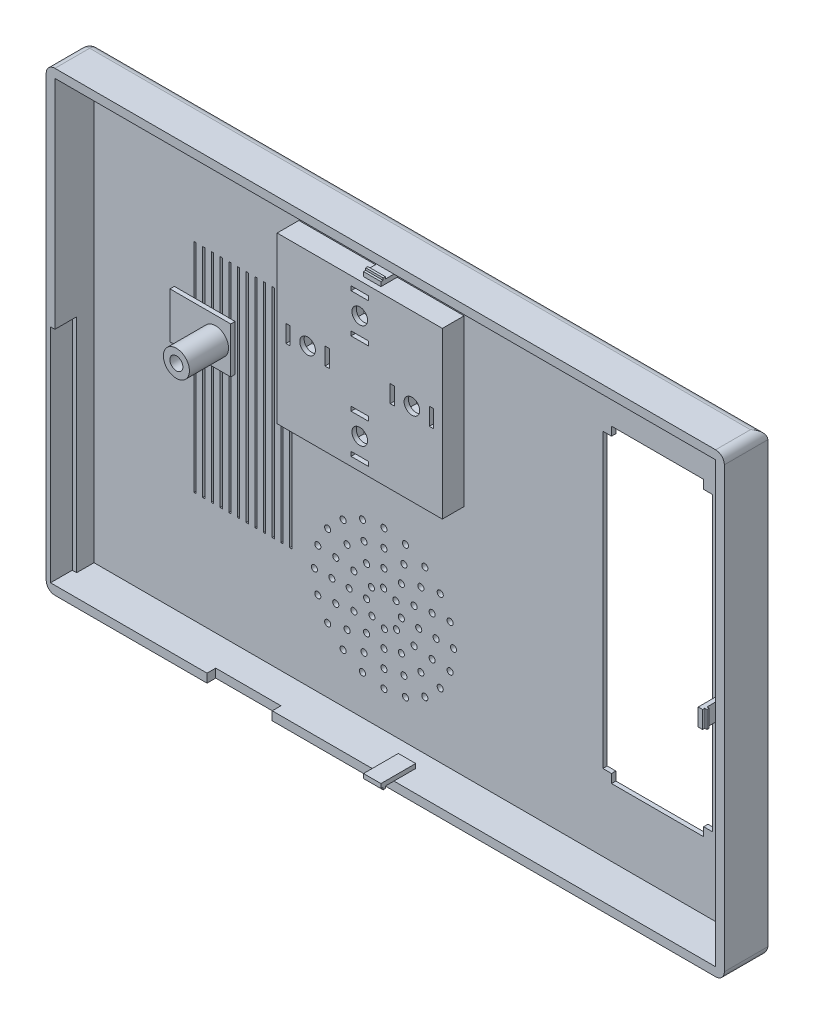
from build123d import *

# Parameters (mm, degrees)
SKETCH2_W                 = 156
SKETCH2_H                 = 105
BOSS_EXTRUDE1_DEPTH       = 10
SHELL1_T                  = -2
SHELL1_THICKNESS_2_FACE_W = 152
SHELL1_THICKNESS_2_FACE_H = 101
SHELL1_THICKNESS_2_DEPTH  = 1
SKETCH3_W                 = 25.2
SKETCH3_H                 = 67.2
CUT_EXTRUDE1_DEPTH        = 1
SKETCH4_W                 = 21.2
SKETCH4_H                 = 2
CUT_EXTRUDE2_DEPTH        = 1
SKETCH5_W                 = 21.2
SKETCH5_H                 = 2
CUT_EXTRUDE3_DEPTH        = 1
SKETCH9_W                 = 38
SKETCH9_H                 = 38
BOSS_EXTRUDE5_DEPTH       = 6
SKETCH10_W                = 10
SKETCH10_H                = 10
CUT_EXTRUDE4_DEPTH        = 5
SKETCH11_W                = 10
SKETCH11_H                = 10
CUT_EXTRUDE5_DEPTH        = 5
SKETCH12_R                = 1.8
CUT_EXTRUDE6_DEPTH        = 1
SKETCH13_R                = 1.8
CUT_EXTRUDE7_DEPTH        = 1
SKETCH20_W                = 0.5
SKETCH20_H                = 50
CUT_EXTRUDE13_DEPTH       = 1
LPATTERN1_COUNT           = 12
LPATTERN1_PITCH           = 2
SKETCH28_R                = 0.7
CUT_EXTRUDE15_DEPTH       = 1
CIRPATTERN1_COUNT         = 12
SKETCH29_R                = 0.7
CUT_EXTRUDE16_DEPTH       = 1
CIRPATTERN2_COUNT         = 8
SKETCH30_R                = 0.7
CUT_EXTRUDE17_DEPTH       = 1
CIRPATTERN3_COUNT         = 16
SKETCH31_R                = 0.7
CUT_EXTRUDE18_DEPTH       = 1
CIRPATTERN4_COUNT         = 20
SKETCH33_W                = 1
SKETCH33_H                = 51
CUT_EXTRUDE19_DEPTH       = 5
SKETCH34_W                = 4
SKETCH34_H                = 8
BOSS_EXTRUDE9_DEPTH       = 1
SKETCH35_W                = 4
SKETCH35_H                = 0.5
BOSS_EXTRUDE10_DEPTH      = 0.5
SKETCH36_W                = 8
SKETCH36_H                = 4
BOSS_EXTRUDE11_DEPTH      = 1
SKETCH37_W                = 0.5
SKETCH37_H                = 4
BOSS_EXTRUDE12_DEPTH      = 0.5
SKETCH38_W                = 15
SKETCH38_H                = 2
CUT_EXTRUDE20_DEPTH       = 2
SKETCH39_W                = 4
SKETCH39_H                = 1
CUT_EXTRUDE21_DEPTH       = 1
SKETCH41_W                = 1
SKETCH41_H                = 4
CUT_EXTRUDE22_DEPTH       = 1
MIRROR12_COPY_1_SKETCH_W  = 4
MIRROR12_COPY_1_SKETCH_H  = 1
MIRROR12_COPY_1_DEPTH     = 1
MIRROR12_COPY_2_SKETCH_W  = 4
MIRROR12_COPY_2_SKETCH_H  = 1
MIRROR12_COPY_2_DEPTH     = 1
MIRROR14_COPY_1_SKETCH_W  = 1
MIRROR14_COPY_1_SKETCH_H  = 4
MIRROR14_COPY_1_DEPTH     = 1
MIRROR14_COPY_2_SKETCH_W  = 1
MIRROR14_COPY_2_SKETCH_H  = 4
MIRROR14_COPY_2_DEPTH     = 1
SKETCH47_W                = 13.975844664
SKETCH47_H                = 10.559527079
BOSS_EXTRUDE17_DEPTH      = 1
SKETCH44_R                = 3
BOSS_EXTRUDE18_DEPTH      = 10
SKETCH48_R                = 1.5
CUT_EXTRUDE23_DEPTH       = 5
FILLET1_R                 = 2
SKETCH49_W                = 2.170940171
SKETCH49_H                = 0.189957265
CUT_EXTRUDE24_DEPTH       = 0.5


with BuildPart() as part:
    # Sketch2 → Boss-Extrude1 (new body)
    with BuildSketch(Plane.XY):
        with Locations((78, 52.5)):
            Rectangle(SKETCH2_W, SKETCH2_H)
    extrude(amount=BOSS_EXTRUDE1_DEPTH)

    # Shell1
    shell1_openings = [part.faces().sort_by_distance(p)[0] for p in [
        (78, 52.5, 10),
    ]]
    offset(amount=SHELL1_T, openings=shell1_openings, kind=Kind.INTERSECTION)

    # Shell1 thickness 2 face (on inner face of the shell) → Shell1 thickness 2 (cut)
    with BuildSketch(Plane(origin=(78, 52.5, 2), x_dir=(-1, 0, 0), z_dir=(0, 0, -1))):
        Rectangle(SHELL1_THICKNESS_2_FACE_W, SHELL1_THICKNESS_2_FACE_H)
    extrude(amount=SHELL1_THICKNESS_2_DEPTH, mode=Mode.SUBTRACT)

    # Sketch3 → Cut-Extrude1 (cut)
    with BuildSketch(Plane(origin=(0, 0, 0), x_dir=(-1, 0, 0), z_dir=(0, 0, -1))):
        with Locations((-131.65, 53.13)):
            Rectangle(SKETCH3_W, SKETCH3_H)
    extrude(amount=-CUT_EXTRUDE1_DEPTH, mode=Mode.SUBTRACT)

    # Sketch4 → Cut-Extrude2 (cut)
    with BuildSketch(Plane(origin=(0, 0, 0), x_dir=(-1, 0, 0), z_dir=(0, 0, -1))):
        with Locations((-131.65, 87.73)):
            Rectangle(SKETCH4_W, SKETCH4_H)
    extrude(amount=-CUT_EXTRUDE2_DEPTH, mode=Mode.SUBTRACT)

    # Sketch5 → Cut-Extrude3 (cut)
    with BuildSketch(Plane(origin=(0, 0, 0), x_dir=(-1, 0, 0), z_dir=(0, 0, -1))):
        with Locations((-131.65, 18.53)):
            Rectangle(SKETCH5_W, SKETCH5_H)
    extrude(amount=-CUT_EXTRUDE3_DEPTH, mode=Mode.SUBTRACT)

    # Sketch9 → Boss-Extrude5 (add)
    with BuildSketch(Plane(origin=(0, 0, 0), x_dir=(-1, 0, 0), z_dir=(0, 0, -1))):
        with Locations((-68.13, 74.75)):
            Rectangle(SKETCH9_W, SKETCH9_H)
    extrude(amount=-BOSS_EXTRUDE5_DEPTH)

    # Sketch10 → Cut-Extrude4 (cut)
    with BuildSketch(Plane(origin=(0, 0, 0), x_dir=(-1, 0, 0), z_dir=(0, 0, -1))):
        with Locations((-80.13, 74.75)):
            Rectangle(SKETCH10_W, SKETCH10_H)
    cut_extrude4 = extrude(amount=-CUT_EXTRUDE4_DEPTH, mode=Mode.SUBTRACT)

    # Mirror3: Cut-Extrude4 across plane
    add(cut_extrude4.mirror(Plane(origin=(68.13, 0, 0), x_dir=(0, 0, 1), z_dir=(1, 0, 0))), mode=Mode.SUBTRACT)

    # Sketch11 → Cut-Extrude5 (cut)
    with BuildSketch(Plane(origin=(0, 0, 0), x_dir=(-1, 0, 0), z_dir=(0, 0, -1))):
        with Locations((-68.13, 86.75)):
            Rectangle(SKETCH11_W, SKETCH11_H)
    cut_extrude5 = extrude(amount=-CUT_EXTRUDE5_DEPTH, mode=Mode.SUBTRACT)

    # Mirror4: Cut-Extrude5 across plane
    add(cut_extrude5.mirror(Plane(origin=(0, 74.75, 0), x_dir=(0, 0, 1), z_dir=(0, -1, 0))), mode=Mode.SUBTRACT)

    # Sketch12 → Cut-Extrude6 (cut)
    with BuildSketch(Plane(origin=(0, 0, 5), x_dir=(-1, 0, 0), z_dir=(0, 0, -1))):
        with Locations((-68.13, 86.75)):
            Circle(SKETCH12_R)
    cut_extrude6 = extrude(amount=-CUT_EXTRUDE6_DEPTH, mode=Mode.SUBTRACT)

    # Mirror5: Cut-Extrude6 across plane
    add(cut_extrude6.mirror(Plane(origin=(0, 74.75, 0), x_dir=(0, 0, 1), z_dir=(0, -1, 0))), mode=Mode.SUBTRACT)

    # Sketch13 → Cut-Extrude7 (cut)
    with BuildSketch(Plane(origin=(0, 0, 5), x_dir=(-1, 0, 0), z_dir=(0, 0, -1))):
        with Locations((-80.13, 74.75)):
            Circle(SKETCH13_R)
    cut_extrude7 = extrude(amount=-CUT_EXTRUDE7_DEPTH, mode=Mode.SUBTRACT)

    # Mirror6: Cut-Extrude7 across plane
    add(cut_extrude7.mirror(Plane(origin=(68.13, 0, 0), x_dir=(0, 0, 1), z_dir=(1, 0, 0))), mode=Mode.SUBTRACT)

    # Sketch20 → Cut-Extrude13 (cut)
    with BuildSketch(Plane(origin=(0, 0, 0), x_dir=(-1, 0, 0), z_dir=(0, 0, -1))):
        with Locations((-25.25, 52.5)):
            Rectangle(SKETCH20_W, SKETCH20_H)
    cut_extrude13 = extrude(amount=-CUT_EXTRUDE13_DEPTH, mode=Mode.SUBTRACT)

    # LPattern1: Cut-Extrude13 ×12
    with Locations(*[(i * LPATTERN1_PITCH, 0, 0) for i in range(1, LPATTERN1_COUNT)]):
        add(cut_extrude13, mode=Mode.SUBTRACT)

    # Sketch28 → Cut-Extrude15 (cut)
    with BuildSketch(Plane(origin=(0, 0, 0), x_dir=(-1, 0, 0), z_dir=(0, 0, -1))):
        with Locations((-68.7, 34.25)):
            Circle(SKETCH28_R)
    cut_extrude15 = extrude(amount=-CUT_EXTRUDE15_DEPTH, mode=Mode.SUBTRACT)

    # CirPattern1: Cut-Extrude15 ×12 about axis
    cirpattern1_axis = Axis((68.7, 26.25, 0), (0, 0, 1))
    for i in range(1, CIRPATTERN1_COUNT):
        add(cut_extrude15.rotate(cirpattern1_axis, i * 360 / CIRPATTERN1_COUNT), mode=Mode.SUBTRACT)

    # Sketch29 → Cut-Extrude16 (cut)
    with BuildSketch(Plane(origin=(0, 0, 0), x_dir=(-1, 0, 0), z_dir=(0, 0, -1))):
        with Locations((-68.612305226, 30.25)):
            Circle(SKETCH29_R)
    cut_extrude16 = extrude(amount=-CUT_EXTRUDE16_DEPTH, mode=Mode.SUBTRACT)

    # CirPattern2: Cut-Extrude16 ×8 about axis
    cirpattern2_axis = Axis((68.7, 26.25, 0), (0, 0, 1))
    for i in range(1, CIRPATTERN2_COUNT):
        add(cut_extrude16.rotate(cirpattern2_axis, i * 360 / CIRPATTERN2_COUNT), mode=Mode.SUBTRACT)

    # Sketch30 → Cut-Extrude17 (cut)
    with BuildSketch(Plane(origin=(0, 0, 0), x_dir=(-1, 0, 0), z_dir=(0, 0, -1))):
        with Locations((-68.7, 38.25)):
            Circle(SKETCH30_R)
    cut_extrude17 = extrude(amount=-CUT_EXTRUDE17_DEPTH, mode=Mode.SUBTRACT)

    # CirPattern3: Cut-Extrude17 ×16 about axis
    cirpattern3_axis = Axis((68.7, 26.25, 0), (0, 0, 1))
    for i in range(1, CIRPATTERN3_COUNT):
        add(cut_extrude17.rotate(cirpattern3_axis, i * 360 / CIRPATTERN3_COUNT), mode=Mode.SUBTRACT)

    # Sketch31 → Cut-Extrude18 (cut)
    with BuildSketch(Plane(origin=(0, 0, 0), x_dir=(-1, 0, 0), z_dir=(0, 0, -1))):
        with Locations((-68.7, 42.25)):
            Circle(SKETCH31_R)
    cut_extrude18 = extrude(amount=-CUT_EXTRUDE18_DEPTH, mode=Mode.SUBTRACT)

    # CirPattern4: Cut-Extrude18 ×20 about axis
    cirpattern4_axis = Axis((68.7, 26.25, 0), (0, 0, 1))
    for i in range(1, CIRPATTERN4_COUNT):
        add(cut_extrude18.rotate(cirpattern4_axis, i * 360 / CIRPATTERN4_COUNT), mode=Mode.SUBTRACT)

    # Sketch33 → Cut-Extrude19 (cut)
    with BuildSketch(Plane.XY.offset(10)):
        with Locations((1.5, 27.5)):
            Rectangle(SKETCH33_W, SKETCH33_H)
    extrude(amount=-CUT_EXTRUDE19_DEPTH, mode=Mode.SUBTRACT)

    # Sketch34 → Boss-Extrude9 (add)
    with BuildSketch(Plane(origin=(0, 2, 0), x_dir=(1, 0, 0), z_dir=(0, 1, 0))):
        with Locations((78, -9)):
            Rectangle(SKETCH34_W, SKETCH34_H)
    boss_extrude9 = extrude(amount=BOSS_EXTRUDE9_DEPTH)

    # Sketch35 → Boss-Extrude10 (add)
    with BuildSketch(Plane.XZ.offset(-2)):
        with Locations((78, 12.25)):
            Rectangle(SKETCH35_W, SKETCH35_H)
    boss_extrude10 = extrude(amount=BOSS_EXTRUDE10_DEPTH)

    # Mirror9: Boss-Extrude9, Boss-Extrude10 across plane
    add(boss_extrude9.mirror(Plane.ZX.offset(52.5)))
    add(boss_extrude10.mirror(Plane.ZX.offset(52.5)))

    # Sketch36 → Boss-Extrude11 (add)
    with BuildSketch(Plane.ZY.offset(-154)):
        with Locations((9, 52.762184436)):
            Rectangle(SKETCH36_W, SKETCH36_H)
    extrude(amount=BOSS_EXTRUDE11_DEPTH)

    # Sketch37 → Boss-Extrude12 (add)
    with BuildSketch(Plane(origin=(154, 0, 0), x_dir=(0, 0, -1), z_dir=(1, 0, 0))):
        with Locations((-12.25, 52.762184436)):
            Rectangle(SKETCH37_W, SKETCH37_H)
    extrude(amount=BOSS_EXTRUDE12_DEPTH)

    # Sketch38 → Cut-Extrude20 (cut)
    with BuildSketch(Plane.XZ):
        with Locations((44.5, 9)):
            Rectangle(SKETCH38_W, SKETCH38_H)
    extrude(amount=-CUT_EXTRUDE20_DEPTH, mode=Mode.SUBTRACT)

    # Sketch39 → Cut-Extrude21 (cut)
    with BuildSketch(Plane(origin=(0, 0, 5), x_dir=(-1, 0, 0), z_dir=(0, 0, -1))):
        with Locations((-68.13, 91.25)):
            Rectangle(SKETCH39_W, SKETCH39_H)
    cut_extrude21 = extrude(amount=-CUT_EXTRUDE21_DEPTH, mode=Mode.SUBTRACT)

    # Sketch41 → Cut-Extrude22 (cut)
    with BuildSketch(Plane(origin=(0, 0, 5), x_dir=(-1, 0, 0), z_dir=(0, 0, -1))):
        with Locations((-84.63, 74.75)):
            Rectangle(SKETCH41_W, SKETCH41_H)
    cut_extrude22 = extrude(amount=-CUT_EXTRUDE22_DEPTH, mode=Mode.SUBTRACT)

    # Mirror10: Cut-Extrude22 across plane
    add(cut_extrude22.mirror(Plane.ZY.offset(-80.13)), mode=Mode.SUBTRACT)

    # Mirror11: Cut-Extrude21 across plane
    add(cut_extrude21.mirror(Plane(origin=(0, 86.75, 0), x_dir=(0, 0, 1), z_dir=(0, -1, 0))), mode=Mode.SUBTRACT)

    # Mirror12 copy 1 sketch → Mirror12 copy 1 (cut)
    with BuildSketch(Plane(origin=(0, -24, 5), x_dir=(-1, 0, 0), z_dir=(0, 0, -1))):
        with Locations((-68.13, 91.25)):
            Rectangle(MIRROR12_COPY_1_SKETCH_W, MIRROR12_COPY_1_SKETCH_H)
    extrude(amount=-MIRROR12_COPY_1_DEPTH, mode=Mode.SUBTRACT)

    # Mirror12 copy 2 sketch → Mirror12 copy 2 (cut)
    with BuildSketch(Plane(origin=(0, 149.5, 5), x_dir=(-1, 0, 0), z_dir=(0, 0, -1))):
        with Locations((-68.13, -91.25)):
            Rectangle(MIRROR12_COPY_2_SKETCH_W, MIRROR12_COPY_2_SKETCH_H)
    extrude(amount=-MIRROR12_COPY_2_DEPTH, mode=Mode.SUBTRACT)

    # Mirror14 copy 1 sketch → Mirror14 copy 1 (cut)
    with BuildSketch(Plane(origin=(-24, 0, 5), x_dir=(-1, 0, 0), z_dir=(0, 0, -1))):
        with Locations((-84.63, 74.75)):
            Rectangle(MIRROR14_COPY_1_SKETCH_W, MIRROR14_COPY_1_SKETCH_H)
    extrude(amount=-MIRROR14_COPY_1_DEPTH, mode=Mode.SUBTRACT)

    # Mirror14 copy 2 sketch → Mirror14 copy 2 (cut)
    with BuildSketch(Plane(origin=(136.26, 0, 5), x_dir=(1, 0, 0), z_dir=(0, 0, -1))):
        with Locations((-84.63, -74.75)):
            Rectangle(MIRROR14_COPY_2_SKETCH_W, MIRROR14_COPY_2_SKETCH_H)
    extrude(amount=-MIRROR14_COPY_2_DEPTH, mode=Mode.SUBTRACT)

    # Sketch47 → Boss-Extrude17 (add)
    with BuildSketch(Plane.XY.offset(1)):
        with Locations((27.46424782, 61.016751115)):
            Rectangle(SKETCH47_W, SKETCH47_H)
    extrude(amount=BOSS_EXTRUDE17_DEPTH)

    # Sketch44 → Boss-Extrude18 (add)
    with BuildSketch(Plane.XY.offset(1)):
        with Locations((30.95, 61.2)):
            Circle(SKETCH44_R)
    extrude(amount=BOSS_EXTRUDE18_DEPTH)

    # Sketch48 → Cut-Extrude23 (cut)
    with BuildSketch(Plane.XY.offset(11)):
        with Locations((30.95, 61.2)):
            Circle(SKETCH48_R)
    extrude(amount=-CUT_EXTRUDE23_DEPTH, mode=Mode.SUBTRACT)

    # Fillet1
    fillet1_edges = [part.edges().sort_by_distance(p)[0] for p in [
        (0, 0, 5),
        (156, 0, 5),
        (156, 105, 5),
        (0, 105, 5),
        (0, 52.5, 0),
        (78, 105, 0),
        (154, 52.5, 1),
        (78, 0, 0),
    ]]
    fillet(fillet1_edges, radius=FILLET1_R)

    # Sketch49 → Cut-Extrude24 (cut)
    # profile 1 of 16: a face of its own
    with BuildSketch(Plane(origin=(0, 0, 0), x_dir=(-1, 0, 0), z_dir=(0, 0, -1))):
        with BuildLine():
            Line((-87.761045391, 74.912820513), (-87.761045391, 75.102777778))
            Line((-87.761045391, 75.102777778), (-87.474837459, 75.102777778))
            add(Edge.make_bspline(
                [(-87.474837459, 75.102777778), (-87.500604695, 75.12300926), (-87.55083712, 75.162449906), (-87.616675816, 75.229399088), (-87.671078232, 75.301329821), (-87.714940799, 75.377788492), (-87.747332908, 75.459260533), (-87.771439692, 75.54458128), (-87.785602598, 75.634722653), (-87.787310918, 75.69634458), (-87.788182143, 75.7277711)],
                knots=[0, 0, 0, 0, 1.07939028, 2.104237756, 3.085658289, 4.045737152, 5.001099604, 5.968961907, 6.964192404, 8, 8, 8, 8], degree=3))
            add(Edge.make_bspline(
                [(-87.788182143, 75.7277711), (-87.787387983, 75.755222213), (-87.785818283, 75.809480779), (-87.775190769, 75.889347588), (-87.756976736, 75.966258416), (-87.730729516, 76.039778144), (-87.698280731, 76.110694378), (-87.657328048, 76.177957267), (-87.609910971, 76.242614513), (-87.555342003, 76.303040018), (-87.496300147, 76.358872464), (-87.432786658, 76.407160392), (-87.366890237, 76.448811496), (-87.297589305, 76.482478771), (-87.22542958, 76.508851438), (-87.150119523, 76.527607934), (-87.071938359, 76.538770413), (-87.018778142, 76.540268077), (-86.991888073, 76.541025641)],
                knots=[0, 0, 0, 0, 1.041296284, 2.058176809, 3.050446431, 4.034000596, 5.01514041, 6.003636468, 7.015969324, 8.052561599, 9.08815499, 10.094063707, 11.074456064, 12.040834395, 13.011057502, 13.983766392, 14.980127149, 16, 16, 16, 16], degree=3))
            add(Edge.make_bspline(
                [(-86.991888073, 76.541025641), (-86.964430486, 76.540284514), (-86.910280163, 76.538822905), (-86.830761776, 76.527486639), (-86.754267031, 76.509369863), (-86.680923162, 76.483329914), (-86.610780668, 76.449680062), (-86.543890133, 76.408734923), (-86.480272989, 76.360422631), (-86.420792902, 76.305207187), (-86.366001889, 76.245303745), (-86.318081723, 76.181273072), (-86.277840034, 76.114108865), (-86.244225577, 76.044154745), (-86.21889078, 75.970811859), (-86.200616206, 75.8944224), (-86.189346772, 75.815027959), (-86.18786381, 75.761022025), (-86.187113767, 75.733707265)],
                knots=[0, 0, 0, 0, 1.038740735, 2.04854663, 3.033179607, 4.009277356, 4.987731542, 5.972001279, 6.972200261, 8.005528982, 9.039189865, 10.040446548, 11.026516639, 11.997840187, 12.972163198, 13.956796175, 14.96660207, 16, 16, 16, 16], degree=3))
            add(Edge.make_bspline(
                [(-86.187113767, 75.733707265), (-86.187957857, 75.702980289), (-86.189624549, 75.642308536), (-86.204417518, 75.553347818), (-86.228713153, 75.468117579), (-86.262785497, 75.386868238), (-86.306545615, 75.309373493), (-86.359813966, 75.235938923), (-86.422581309, 75.166200982), (-86.470194648, 75.124225038), (-86.494522288, 75.102777778)],
                knots=[0, 0, 0, 0, 1.014661154, 2.003492687, 2.970165371, 3.937187664, 4.907406957, 5.904113462, 6.929124205, 8, 8, 8, 8], degree=3))
            Line((-86.494522288, 75.102777778), (-85.644378725, 75.102777778))
            Line((-85.644378725, 75.102777778), (-85.644378725, 74.912820513))
            Line((-85.644378725, 74.912820513), (-87.761045391, 74.912820513))
        make_face()
        with BuildLine():
            add(Edge.make_bspline(
                [(-87.598224878, 75.726075053), (-87.597837675, 75.704557889), (-87.59707537, 75.66219614), (-87.588019696, 75.600103893), (-87.574873539, 75.540295706), (-87.554969675, 75.483374335), (-87.530538012, 75.4287942), (-87.500008415, 75.376975682), (-87.463933154, 75.327955153), (-87.423003265, 75.281855949), (-87.377903335, 75.240210052), (-87.32977166, 75.203341996), (-87.278669194, 75.172373768), (-87.225071951, 75.146670166), (-87.168559803, 75.12711018), (-87.1094546, 75.113227436), (-87.04769165, 75.104500508), (-87.005626827, 75.103358151), (-86.984255861, 75.102777778)],
                knots=[0, 0, 0, 0, 1.05670511, 2.080379991, 3.077984906, 4.06214886, 5.038337365, 6.01289324, 7.01187578, 8.025460281, 9.038092164, 10.024533457, 11.000252242, 11.969694649, 12.940728589, 13.933144304, 14.949937299, 16, 16, 16, 16], degree=3))
            add(Edge.make_bspline(
                [(-86.984255861, 75.102777778), (-86.956203169, 75.103743911), (-86.901245569, 75.105636649), (-86.82105991, 75.120877286), (-86.745247684, 75.145959353), (-86.674302254, 75.18142122), (-86.608663508, 75.225718002), (-86.550572626, 75.280057849), (-86.499268649, 75.342420336), (-86.456056089, 75.412630768), (-86.421144914, 75.487966628), (-86.395362035, 75.566285095), (-86.380058748, 75.647036569), (-86.37807233, 75.701559591), (-86.377071032, 75.729043136)],
                knots=[0, 0, 0, 0, 1.037533453, 2.032615907, 3.008487753, 3.983910949, 4.958815134, 5.928528047, 6.917017829, 7.938835504, 8.970843303, 9.983125212, 10.983349323, 12, 12, 12, 12], degree=3))
            add(Edge.make_bspline(
                [(-86.377071032, 75.729043136), (-86.378012297, 75.75597664), (-86.379880539, 75.809434804), (-86.396050372, 75.888149942), (-86.420753432, 75.964644883), (-86.456766909, 76.037332037), (-86.500930513, 76.105538055), (-86.553871506, 76.167326738), (-86.615652262, 76.220855071), (-86.683986656, 76.266914869), (-86.757195464, 76.30373781), (-86.832805167, 76.331708986), (-86.910802121, 76.347644392), (-86.963411614, 76.349925555), (-86.989768014, 76.351068376)],
                knots=[0, 0, 0, 0, 1.001123591, 1.987050352, 2.978152323, 3.984730168, 4.995502505, 5.994801396, 7.000994558, 8.027767845, 9.053126238, 10.042874082, 11.019515457, 12, 12, 12, 12], degree=3))
            add(Edge.make_bspline(
                [(-86.989768014, 76.351068376), (-87.016289389, 76.350188011), (-87.06912551, 76.34843414), (-87.147003152, 76.331178891), (-87.223109265, 76.305200072), (-87.295386855, 76.267553847), (-87.363213557, 76.222207075), (-87.423880624, 76.168575776), (-87.47599422, 76.107088394), (-87.520192836, 76.039411745), (-87.554696881, 75.96607977), (-87.580072457, 75.889117033), (-87.595284354, 75.808648688), (-87.597236082, 75.753841715), (-87.598224878, 75.726075053)],
                knots=[0, 0, 0, 0, 0.984010603, 1.960354772, 2.950163297, 3.964735994, 4.97843856, 5.975353722, 6.962442164, 7.964544167, 8.969901786, 9.964615439, 10.968820376, 12, 12, 12, 12], degree=3))
        make_face(mode=Mode.SUBTRACT)
    # profile 2 of 16: a face of its own
    with BuildSketch(Plane(origin=(0, 0, 0), x_dir=(-1, 0, 0), z_dir=(0, 0, -1))):
        with BuildLine():
            Line((-88.330917186, 73.040384615), (-88.330917186, 73.23034188))
            Line((-88.330917186, 73.23034188), (-87.062698036, 73.23034188))
            add(Edge.make_bspline(
                [(-87.062698036, 73.23034188), (-87.044748257, 73.230313611), (-87.01068546, 73.230259966), (-86.962202726, 73.230618296), (-86.919099857, 73.231621819), (-86.881210709, 73.232254496), (-86.848709143, 73.233661979), (-86.821419074, 73.234809845), (-86.799469723, 73.236285801), (-86.786660306, 73.238059639), (-86.781154232, 73.238822115)],
                knots=[0, 0, 0, 0, 1.528628734, 2.90083645, 4.128790002, 5.200304208, 6.127813768, 6.898992206, 7.526736466, 8, 8, 8, 8], degree=3))
            add(Edge.make_bspline(
                [(-86.781154232, 73.238822115), (-86.761137456, 73.241917579), (-86.722495969, 73.247893232), (-86.667509402, 73.263769428), (-86.617861523, 73.284934955), (-86.572432452, 73.311192056), (-86.531510896, 73.344368017), (-86.494782776, 73.385556998), (-86.46140625, 73.434020534), (-86.432306718, 73.489064287), (-86.408137105, 73.547713501), (-86.390052031, 73.607865605), (-86.378983977, 73.668359662), (-86.377705767, 73.70886536), (-86.377071032, 73.728979701)],
                knots=[0, 0, 0, 0, 1.042777144, 2.01303441, 2.939567723, 3.817555404, 4.708046775, 5.641195415, 6.651191522, 7.732783915, 8.843021186, 9.914367358, 10.964315445, 12, 12, 12, 12], degree=3))
            add(Edge.make_bspline(
                [(-86.377071032, 73.728979701), (-86.377716856, 73.746249433), (-86.379004774, 73.780689153), (-86.387078397, 73.831833289), (-86.401342168, 73.881802157), (-86.420772029, 73.930203207), (-86.444665548, 73.976249842), (-86.473289596, 74.018761483), (-86.506631068, 74.056858816), (-86.543582622, 74.091624755), (-86.58522275, 74.121720838), (-86.630546879, 74.148330482), (-86.680763557, 74.16946343), (-86.71603338, 74.180162978), (-86.734088928, 74.185640358)],
                knots=[0, 0, 0, 0, 0.994718802, 1.98369237, 2.973235266, 3.981451368, 4.982709966, 5.955777334, 6.925228988, 7.892833478, 8.871333226, 9.877970804, 10.913677552, 12, 12, 12, 12], degree=3))
            add(Edge.make_bspline(
                [(-86.734088928, 74.185640358), (-86.741556875, 74.187454719), (-86.758198471, 74.191497848), (-86.786332775, 74.195275823), (-86.819527772, 74.199210722), (-86.858021963, 74.201940961), (-86.901686361, 74.204602652), (-86.950748431, 74.206195034), (-87.005030022, 74.206931049), (-87.042910591, 74.207150384), (-87.062698036, 74.207264957)],
                knots=[0, 0, 0, 0, 0.558680831, 1.244966039, 2.062412453, 2.990489873, 4.051219941, 5.244515665, 6.560634259, 8, 8, 8, 8], degree=3))
            Line((-87.062698036, 74.207264957), (-88.330917186, 74.207264957))
            Line((-88.330917186, 74.207264957), (-88.330917186, 74.397222222))
            Line((-88.330917186, 74.397222222), (-87.052521753, 74.397222222))
            add(Edge.make_bspline(
                [(-87.052521753, 74.397222222), (-87.02948131, 74.397068518), (-86.984516483, 74.396768555), (-86.918626788, 74.394168034), (-86.856123066, 74.390020108), (-86.796995635, 74.384164808), (-86.741460473, 74.376388828), (-86.689151783, 74.367821471), (-86.640357961, 74.35672029), (-86.594516052, 74.343849674), (-86.55065833, 74.329346248), (-86.509116706, 74.310231654), (-86.468671099, 74.288789398), (-86.42977439, 74.263563713), (-86.392673709, 74.234542661), (-86.356408659, 74.202838071), (-86.322060039, 74.167332449), (-86.289204211, 74.12907452), (-86.258648283, 74.08832151), (-86.232057699, 74.04481028), (-86.210405753, 73.998781049), (-86.191189225, 73.951323757), (-86.177530606, 73.901300587), (-86.167145334, 73.849334648), (-86.161293982, 73.795117706), (-86.160419726, 73.758249508), (-86.159977015, 73.739579995)],
                knots=[0, 0, 0, 0, 1.316707045, 2.569633854, 3.76780728, 4.896239288, 5.964314126, 6.972204208, 7.924543903, 8.822147865, 9.693191779, 10.560896119, 11.431827672, 12.307838457, 13.206132673, 14.12176355, 15.058527151, 16.026630406, 17.00238624, 17.966538933, 18.934743273, 19.906713913, 20.888635248, 21.892958714, 22.933025263, 24, 24, 24, 24], degree=3))
            add(Edge.make_bspline(
                [(-86.159977015, 73.739579995), (-86.160451282, 73.719218055), (-86.161381793, 73.679268003), (-86.166722115, 73.620403755), (-86.176755311, 73.563963207), (-86.189613342, 73.509395517), (-86.207057399, 73.457227867), (-86.228491492, 73.407475633), (-86.252961767, 73.359567553), (-86.281877254, 73.314582986), (-86.313407646, 73.27215291), (-86.348040325, 73.233593671), (-86.3844563, 73.197926442), (-86.424026817, 73.166723354), (-86.46594183, 73.138804201), (-86.510398485, 73.114784198), (-86.557337186, 73.094151854), (-86.589966285, 73.083504338), (-86.60646139, 73.078121661)],
                knots=[0, 0, 0, 0, 1.138939089, 2.234594419, 3.301501784, 4.342532435, 5.367382236, 6.373123747, 7.370098489, 8.372230273, 9.360297234, 10.323289009, 11.268038109, 12.20748145, 13.137029304, 14.081414587, 15.030090602, 16, 16, 16, 16], degree=3))
            add(Edge.make_bspline(
                [(-86.60646139, 73.078121661), (-86.617729661, 73.074990713), (-86.642170793, 73.068199617), (-86.682621193, 73.060927175), (-86.729196881, 73.054813588), (-86.781901046, 73.049064988), (-86.840774536, 73.045672904), (-86.905791833, 73.042699025), (-86.977031553, 73.040363665), (-87.026654998, 73.040377437), (-87.052521753, 73.040384615)],
                knots=[0, 0, 0, 0, 0.625038921, 1.35572334, 2.194682327, 3.136881307, 4.189498639, 5.346923369, 6.617055217, 8, 8, 8, 8], degree=3))
            Line((-87.052521753, 73.040384615), (-88.330917186, 73.040384615))
        make_face()
    # profile 3 of 16: a face of its own
    with BuildSketch(Plane(origin=(0, 0, 0), x_dir=(-1, 0, 0), z_dir=(0, 0, -1))):
        with BuildLine():
            Line((-49.971527301, 77.314423077), (-49.971527301, 77.504380342))
            Line((-49.971527301, 77.504380342), (-49.692527568, 77.504380342))
            add(Edge.make_bspline(
                [(-49.692527568, 77.504380342), (-49.71787029, 77.524627614), (-49.766971483, 77.56385644), (-49.830998952, 77.62985812), (-49.88472824, 77.698678236), (-49.92703233, 77.771434534), (-49.959027018, 77.847378336), (-49.982098958, 77.926294154), (-49.995941345, 78.008609121), (-49.997749379, 78.064588842), (-49.998664053, 78.092908654)],
                knots=[0, 0, 0, 0, 1.127869841, 2.185233117, 3.191641716, 4.159226741, 5.10472073, 6.052603964, 7.014823782, 8, 8, 8, 8], degree=3))
            add(Edge.make_bspline(
                [(-49.998664053, 78.092908654), (-49.997669828, 78.121546858), (-49.995722915, 78.177626828), (-49.978518536, 78.258971914), (-49.951451319, 78.335410624), (-49.913018832, 78.405816264), (-49.865556102, 78.469433567), (-49.810178169, 78.525105107), (-49.746814675, 78.571527524), (-49.687686212, 78.60255676), (-49.635142053, 78.622608085), (-49.590203147, 78.635787965), (-49.540114381, 78.646449914), (-49.485000873, 78.656003718), (-49.42464087, 78.662377084), (-49.359178553, 78.667429185), (-49.28862522, 78.671042806), (-49.239829096, 78.671186556), (-49.214666323, 78.671260684)],
                knots=[0, 0, 0, 0, 1.235846195, 2.420061613, 3.574938557, 4.72781258, 5.870749808, 6.993217613, 8.10690044, 9.251157787, 9.865716151, 10.534141144, 11.271861846, 12.076851687, 12.949307443, 13.892392281, 14.913166647, 16, 16, 16, 16], degree=3))
            Line((-49.214666323, 78.671260684), (-48.424732429, 78.671260684))
            Line((-48.424732429, 78.671260684), (-48.424732429, 78.481303419))
            Line((-48.424732429, 78.481303419), (-49.152336596, 78.481303419))
            add(Edge.make_bspline(
                [(-49.152336596, 78.481303419), (-49.173395914, 78.481187057), (-49.213678806, 78.480964478), (-49.271353966, 78.480253264), (-49.323517975, 78.4785791), (-49.37032075, 78.47612987), (-49.411590988, 78.472701567), (-49.447537592, 78.469031506), (-49.477842154, 78.464580262), (-49.496084823, 78.46061096), (-49.50426635, 78.458830796)],
                knots=[0, 0, 0, 0, 1.430803381, 2.736883362, 3.918614142, 4.976458302, 5.92063272, 6.731858525, 7.431260095, 8, 8, 8, 8], degree=3))
            add(Edge.make_bspline(
                [(-49.50426635, 78.458830796), (-49.528299415, 78.452436776), (-49.57443261, 78.440162997), (-49.636901703, 78.40921732), (-49.69051766, 78.371046159), (-49.734177801, 78.323752965), (-49.768166097, 78.268607918), (-49.791730879, 78.205519343), (-49.80647422, 78.135140175), (-49.807941839, 78.085637443), (-49.808706788, 78.059835737)],
                knots=[0, 0, 0, 0, 1.084232, 2.08126119, 3.027460722, 3.945137793, 4.874029258, 5.839697328, 6.874011781, 8, 8, 8, 8], degree=3))
            add(Edge.make_bspline(
                [(-49.808706788, 78.059835737), (-49.80842306, 78.044553447), (-49.807861568, 78.014310188), (-49.802085402, 77.969486914), (-49.79295426, 77.925874983), (-49.779497526, 77.883573682), (-49.762980576, 77.842445721), (-49.743110116, 77.802202431), (-49.718648991, 77.76377251), (-49.691302674, 77.726523573), (-49.66102118, 77.691861236), (-49.629061668, 77.659610738), (-49.595028631, 77.630861437), (-49.559468583, 77.604815173), (-49.521893635, 77.582331168), (-49.482666168, 77.562704779), (-49.441734584, 77.546052239), (-49.413325857, 77.537777468), (-49.399111435, 77.533637153)],
                knots=[0, 0, 0, 0, 1.023827899, 2.026128959, 3.023898047, 4.006668367, 4.997079741, 5.992687789, 7.009920206, 8.046337072, 9.087246971, 10.092051999, 11.086713115, 12.070168086, 13.043348831, 14.017773728, 15.008185103, 16, 16, 16, 16], degree=3))
            add(Edge.make_bspline(
                [(-49.399111435, 77.533637153), (-49.388676146, 77.531254603), (-49.365959067, 77.526067918), (-49.32867887, 77.5204659), (-49.285553314, 77.515381318), (-49.236632722, 77.511125634), (-49.181745817, 77.508521882), (-49.121127001, 77.50568289), (-49.054534558, 77.504649315), (-49.008172486, 77.50447251), (-48.98400393, 77.504380342)],
                knots=[0, 0, 0, 0, 0.615963638, 1.340920617, 2.168419149, 3.115676021, 4.16674242, 5.331190069, 6.6087489, 8, 8, 8, 8], degree=3))
            Line((-48.98400393, 77.504380342), (-48.424732429, 77.504380342))
            Line((-48.424732429, 77.504380342), (-48.424732429, 77.314423077))
            Line((-48.424732429, 77.314423077), (-49.971527301, 77.314423077))
        make_face()
    # profile 4 of 16: a face of its own
    with BuildSketch(Plane(origin=(0, 0, 0), x_dir=(-1, 0, 0), z_dir=(0, 0, -1))):
        Polygon((-49.971527301, 74.655021368), (-49.971527301, 74.85897102), (-48.858920463, 75.319871795), (-49.971527301, 75.824869792), (-49.971527301, 75.857094685), (-48.858920463, 76.351068376), (-49.971527301, 76.816209268), (-49.971527301, 77.015918803), (-48.424732429, 76.369300881), (-48.424732429, 76.329867788), (-49.537339267, 75.835470085), (-48.424732429, 75.3308961), (-48.424732429, 75.295703125), align=None)
    # profile 5 of 16: a face of its own
    with BuildSketch(Plane(origin=(0, 0, 0), x_dir=(-1, 0, 0), z_dir=(0, 0, -1))):
        with BuildLine():
            add(Edge.make_bspline(
                [(-49.998664053, 73.69251469), (-49.998046052, 73.721537984), (-49.996834304, 73.77844557), (-49.983883348, 73.861786529), (-49.96407899, 73.941340016), (-49.936700474, 74.017410713), (-49.900002342, 74.089024378), (-49.856211961, 74.15722413), (-49.804333916, 74.221822988), (-49.764203084, 74.260541677), (-49.74383299, 74.280194979)],
                knots=[0, 0, 0, 0, 1.054011418, 2.066658804, 3.057071809, 4.030435133, 4.997543892, 5.974964718, 6.972108034, 8, 8, 8, 8], degree=3))
            add(Edge.make_bspline(
                [(-49.74383299, 74.280194979), (-49.724351199, 74.297117398), (-49.685764642, 74.330634743), (-49.623198629, 74.373612582), (-49.558404377, 74.41063705), (-49.49052147, 74.440308459), (-49.420142502, 74.463703688), (-49.347025572, 74.480313895), (-49.271332152, 74.490193851), (-49.219925069, 74.491526121), (-49.193889747, 74.492200855)],
                knots=[0, 0, 0, 0, 1.025258237, 2.030674902, 3.01204498, 3.988269485, 4.97094183, 5.956517959, 6.965070386, 8, 8, 8, 8], degree=3))
            add(Edge.make_bspline(
                [(-49.193889747, 74.492200855), (-49.167703522, 74.491607379), (-49.11595832, 74.490434644), (-49.039746608, 74.479341124), (-48.965847834, 74.46208661), (-48.894571386, 74.43739307), (-48.82569939, 74.40572888), (-48.759532663, 74.367090226), (-48.695940659, 74.321205962), (-48.635463356, 74.269194021), (-48.579724741, 74.211710268), (-48.531145263, 74.149349549), (-48.489524627, 74.083337348), (-48.455998795, 74.012795892), (-48.429564833, 73.938369364), (-48.410998633, 73.859897232), (-48.399773234, 73.777501404), (-48.398331739, 73.721242084), (-48.397595677, 73.69251469)],
                knots=[0, 0, 0, 0, 0.998656419, 1.973391657, 2.932242238, 3.890759089, 4.846373663, 5.82037756, 6.809684879, 7.83454468, 8.860553229, 9.859544525, 10.845671541, 11.83227036, 12.833544569, 13.85385346, 14.904124723, 16, 16, 16, 16], degree=3))
            add(Edge.make_bspline(
                [(-48.397595677, 73.69251469), (-48.39833421, 73.66364655), (-48.399780664, 73.60710684), (-48.410955021, 73.524420175), (-48.429556277, 73.445807405), (-48.456085665, 73.371283443), (-48.489525699, 73.300438702), (-48.531019435, 73.234044011), (-48.579739148, 73.171632634), (-48.635459453, 73.114136719), (-48.695941664, 73.062128039), (-48.759532402, 73.016242934), (-48.825699458, 72.977604499), (-48.894571368, 72.945940252), (-48.965847839, 72.921246727), (-49.039746607, 72.903992209), (-49.11595832, 72.892898689), (-49.167703522, 72.891725954), (-49.193889747, 72.891132479)],
                knots=[0, 0, 0, 0, 1.099876186, 2.154163076, 3.173186993, 4.173200201, 5.163417411, 6.152872554, 7.150605724, 8.17532212, 9.198891216, 10.186952605, 11.159729845, 12.11414092, 13.071450619, 14.029093627, 15.002601286, 16, 16, 16, 16], degree=3))
            add(Edge.make_bspline(
                [(-49.193889747, 72.891132479), (-49.219784141, 72.8918102), (-49.27105059, 72.893151972), (-49.346593335, 72.903045411), (-49.419486485, 72.919474886), (-49.489481127, 72.943194439), (-49.557200879, 72.97281077), (-49.622232701, 73.009462602), (-49.684525327, 73.05285618), (-49.723060714, 73.08624331), (-49.742560955, 73.103138355)],
                knots=[0, 0, 0, 0, 1.031377469, 2.041950136, 3.029500481, 4.003457997, 4.981637986, 5.969878303, 6.97268806, 8, 8, 8, 8], degree=3))
            add(Edge.make_bspline(
                [(-49.742560955, 73.103138355), (-49.763107704, 73.122762026), (-49.803516501, 73.16135543), (-49.855243313, 73.226275851), (-49.899944939, 73.294307828), (-49.935913888, 73.366712903), (-49.964240039, 73.442721107), (-49.983934422, 73.522682268), (-49.996787642, 73.606306032), (-49.998032349, 73.663492089), (-49.998664053, 73.69251469)],
                knots=[0, 0, 0, 0, 1.027980169, 2.021703884, 2.998553061, 3.971491411, 4.943284454, 5.930300938, 6.949603206, 8, 8, 8, 8], degree=3))
        make_face()
        with BuildLine():
            add(Edge.make_bspline(
                [(-49.808706788, 73.691666667), (-49.80812344, 73.671142492), (-49.806971802, 73.630623971), (-49.798212488, 73.570982604), (-49.784334713, 73.513566414), (-49.764617018, 73.458266483), (-49.739157222, 73.405269247), (-49.707885921, 73.354524158), (-49.671217631, 73.305881214), (-49.62920843, 73.260294829), (-49.58332276, 73.218449264), (-49.534417719, 73.181898823), (-49.483242432, 73.15064426), (-49.42971989, 73.125079882), (-49.3736676, 73.10547382), (-49.315415657, 73.091580592), (-49.254788159, 73.082805239), (-49.213565706, 73.08166777), (-49.192617712, 73.081089744)],
                knots=[0, 0, 0, 0, 1.02155314, 2.01673505, 2.994700672, 3.958461264, 4.934171024, 5.916582427, 6.921469794, 7.962398674, 8.998583302, 10.009097305, 10.997513862, 11.97957236, 12.956600784, 13.948243505, 14.957359924, 16, 16, 16, 16], degree=3))
            add(Edge.make_bspline(
                [(-49.192617712, 73.081089744), (-49.165553391, 73.082061489), (-49.111835774, 73.083990223), (-49.032726191, 73.099674866), (-48.956779071, 73.125913235), (-48.884439637, 73.16134459), (-48.817509259, 73.205737875), (-48.757836505, 73.258041958), (-48.706319371, 73.317695491), (-48.663574288, 73.383987374), (-48.629611007, 73.455563557), (-48.605542103, 73.531313808), (-48.589895889, 73.610320323), (-48.588340759, 73.664313908), (-48.587552942, 73.691666667)],
                knots=[0, 0, 0, 0, 1.016792936, 2.018143844, 3.017858371, 4.030088057, 5.03801393, 6.028138512, 7.003788237, 7.991172063, 8.984598303, 9.972568034, 10.972917682, 12, 12, 12, 12], degree=3))
            add(Edge.make_bspline(
                [(-48.587552942, 73.691666667), (-48.588345349, 73.719017852), (-48.58990954, 73.773008331), (-48.605463302, 73.851905071), (-48.629716469, 73.927448283), (-48.663536091, 73.998950122), (-48.706481694, 74.06521183), (-48.757545598, 74.125294394), (-48.817667308, 74.177151887), (-48.88452829, 74.221501258), (-48.956666922, 74.257512859), (-49.032740208, 74.283628415), (-49.111832204, 74.299350764), (-49.165552195, 74.301274408), (-49.192617712, 74.30224359)],
                knots=[0, 0, 0, 0, 1.02726834, 2.027799167, 3.010890988, 4.004497153, 4.992059811, 5.971914811, 6.958719428, 7.966827853, 8.981595046, 9.981490638, 10.983022906, 12, 12, 12, 12], degree=3))
            add(Edge.make_bspline(
                [(-49.192617712, 74.30224359), (-49.213565831, 74.301665762), (-49.25478853, 74.300528686), (-49.315414237, 74.291750479), (-49.373672793, 74.27786779), (-49.429700768, 74.258222973), (-49.483381296, 74.232772151), (-49.534267709, 74.200916755), (-49.583492131, 74.164515601), (-49.629060093, 74.122165178), (-49.671234006, 74.076626373), (-49.70790014, 74.027963717), (-49.739019788, 73.977293874), (-49.764834786, 73.924450605), (-49.784155324, 73.869143584), (-49.798292619, 73.811807842), (-49.806934786, 73.752420943), (-49.808112343, 73.712047617), (-49.808706788, 73.691666667)],
                knots=[0, 0, 0, 0, 1.042975879, 2.052417305, 3.044379404, 4.0217225, 5.00409729, 5.996508862, 7.007348322, 8.048612455, 9.089876587, 10.095087598, 11.077815406, 12.047498138, 13.018202342, 13.98964644, 14.985148868, 16, 16, 16, 16], degree=3))
        make_face(mode=Mode.SUBTRACT)
    # profile 6 of 16: a face of its own
    with BuildSketch(Plane(origin=(0, 0, 0), x_dir=(-1, 0, 0), z_dir=(0, 0, -1))):
        with BuildLine():
            Line((-48.424732429, 70.828739316), (-50.541399096, 70.828739316))
            Line((-50.541399096, 70.828739316), (-50.541399096, 71.256143162))
            add(Edge.make_bspline(
                [(-50.541399096, 71.256143162), (-50.541131446, 71.293317265), (-50.540614349, 71.365137437), (-50.537335698, 71.468922108), (-50.53153575, 71.564948478), (-50.523087512, 71.652900731), (-50.512714011, 71.733020321), (-50.499711386, 71.805082908), (-50.484357587, 71.869461109), (-50.471267244, 71.909054532), (-50.46507698, 71.927777778)],
                knots=[0, 0, 0, 0, 1.314313732, 2.53924729, 3.670748893, 4.714932338, 5.66265055, 6.526160246, 7.303039223, 8, 8, 8, 8], degree=3))
            add(Edge.make_bspline(
                [(-50.46507698, 71.927777778), (-50.455747983, 71.952269659), (-50.437301541, 72.000698027), (-50.402451494, 72.069613173), (-50.363127063, 72.134710164), (-50.318423284, 72.195469987), (-50.268923912, 72.252045098), (-50.21498257, 72.305077605), (-50.155400975, 72.353259993), (-50.091239644, 72.397342701), (-50.023320663, 72.437099711), (-49.951755268, 72.471654598), (-49.876911849, 72.500353155), (-49.798997197, 72.524176626), (-49.717840358, 72.542952355), (-49.633346729, 72.555762376), (-49.545850268, 72.5642115), (-49.486478092, 72.565060617), (-49.456353022, 72.565491453)],
                knots=[0, 0, 0, 0, 0.984741985, 1.947153288, 2.898543998, 3.841229145, 4.778974371, 5.722123648, 6.681464302, 7.655713756, 8.646344578, 9.637374342, 10.639946623, 11.656849581, 12.698333139, 13.76849723, 14.867749466, 16, 16, 16, 16], degree=3))
            add(Edge.make_bspline(
                [(-49.456353022, 72.565491453), (-49.430190273, 72.565111077), (-49.378633844, 72.564361507), (-49.302651013, 72.557630925), (-49.228922342, 72.547848087), (-49.15779885, 72.532702366), (-49.088657664, 72.514315881), (-49.022234703, 72.490752591), (-48.957924229, 72.463756017), (-48.896582675, 72.432288258), (-48.83850464, 72.397694907), (-48.783714681, 72.360802137), (-48.733428607, 72.320773246), (-48.686328693, 72.278792971), (-48.643673162, 72.233848961), (-48.60468446, 72.186488404), (-48.570015342, 72.136527243), (-48.539121017, 72.083656206), (-48.511493077, 72.027169186), (-48.48844806, 71.96528938), (-48.468488723, 71.898309901), (-48.452611069, 71.825848781), (-48.439805627, 71.748164468), (-48.431279715, 71.665041462), (-48.425497536, 71.576636855), (-48.424992417, 71.51593109), (-48.424732429, 71.484685497)],
                knots=[0, 0, 0, 0, 1.106010661, 2.179509527, 3.223302912, 4.248870533, 5.252098245, 6.246278179, 7.226402005, 8.199283979, 9.158616973, 10.083547221, 10.989831858, 11.874256832, 12.749262829, 13.607058236, 14.46581075, 15.317568432, 16.194266721, 17.121067875, 18.106207572, 19.147242834, 20.255495536, 21.43354536, 22.679031616, 24, 24, 24, 24], degree=3))
            Line((-48.424732429, 71.484685497), (-48.424732429, 70.828739316))
        make_face()
        with BuildLine():
            Line((-48.641826446, 71.018696581), (-48.641826446, 71.261655315))
            add(Edge.make_bspline(
                [(-48.641826446, 71.261655315), (-48.641976485, 71.296567235), (-48.642265066, 71.363715641), (-48.644797327, 71.460270716), (-48.64893507, 71.548493018), (-48.654725712, 71.628395073), (-48.662387208, 71.699931769), (-48.670929411, 71.763252608), (-48.681571679, 71.818150026), (-48.691218212, 71.851369257), (-48.695675939, 71.866720085)],
                knots=[0, 0, 0, 0, 1.375205317, 2.645023457, 3.804390687, 4.853969522, 5.800190428, 6.637939096, 7.370582563, 8, 8, 8, 8], degree=3))
            add(Edge.make_bspline(
                [(-48.695675939, 71.866720085), (-48.702480451, 71.88604124), (-48.715926951, 71.924222063), (-48.740454697, 71.979183452), (-48.769508643, 72.030441367), (-48.801804552, 72.078888467), (-48.83848002, 72.123839858), (-48.878743086, 72.165819432), (-48.922777701, 72.204775793), (-48.970512461, 72.240108909), (-49.021429742, 72.27211258), (-49.075619593, 72.29958639), (-49.132320187, 72.323512478), (-49.191990548, 72.342457608), (-49.254193324, 72.357395012), (-49.319251062, 72.367865298), (-49.387106195, 72.374365409), (-49.433300208, 72.375140347), (-49.456777034, 72.375534188)],
                knots=[0, 0, 0, 0, 0.998590647, 1.973329978, 2.929871262, 3.868367705, 4.809062953, 5.754642869, 6.701828697, 7.672172887, 8.647399344, 9.630604387, 10.631475358, 11.644913558, 12.679592956, 13.747988925, 14.855477812, 16, 16, 16, 16], degree=3))
            add(Edge.make_bspline(
                [(-49.456777034, 72.375534188), (-49.481532043, 72.375223771), (-49.530163479, 72.374613955), (-49.601519756, 72.366949015), (-49.670148531, 72.355747884), (-49.736054392, 72.339550131), (-49.799365919, 72.318909076), (-49.859732956, 72.293149459), (-49.917793043, 72.263717742), (-49.972206112, 72.228700009), (-50.023667183, 72.190348674), (-50.070811346, 72.147786814), (-50.113745994, 72.101690629), (-50.153139769, 72.052562886), (-50.187407802, 71.999019022), (-50.218061176, 71.942320361), (-50.244075548, 71.881635122), (-50.257911813, 71.839415063), (-50.264943433, 71.817958734)],
                knots=[0, 0, 0, 0, 1.122418816, 2.205001699, 3.251619955, 4.274784885, 5.280384055, 6.268708349, 7.249350384, 8.229342522, 9.199999885, 10.157847722, 11.105861043, 12.055065948, 13.010012805, 13.98527497, 14.976112212, 16, 16, 16, 16], degree=3))
            add(Edge.make_bspline(
                [(-50.264943433, 71.817958734), (-50.26985194, 71.800208279), (-50.280288771, 71.762465941), (-50.291673639, 71.700877313), (-50.301715408, 71.631562437), (-50.310217174, 71.55421357), (-50.316317602, 71.468918882), (-50.320896445, 71.375612776), (-50.323984741, 71.27425492), (-50.324195626, 71.203992149), (-50.324305079, 71.167524706)],
                knots=[0, 0, 0, 0, 0.674548936, 1.434276114, 2.292660221, 3.240891867, 4.284742987, 5.42552168, 6.663806718, 8, 8, 8, 8], degree=3))
            Line((-50.324305079, 71.167524706), (-50.324305079, 71.018696581))
            Line((-50.324305079, 71.018696581), (-48.641826446, 71.018696581))
        make_face(mode=Mode.SUBTRACT)
    # profile 7 of 16: a face of its own
    with BuildSketch(Plane(origin=(0, 0, 0), x_dir=(-1, 0, 0), z_dir=(0, 0, -1))):
        with BuildLine():
            Line((-68.63876464, 92.628935797), (-68.63876464, 93.041923244))
            add(Edge.make_bspline(
                [(-68.63876464, 93.041923244), (-68.638660026, 93.062139833), (-68.638457258, 93.101324613), (-68.635239482, 93.15830061), (-68.630961752, 93.211685138), (-68.62378609, 93.261383862), (-68.616345876, 93.307720164), (-68.605425423, 93.350223632), (-68.593363384, 93.389250286), (-68.5748043, 93.436113309), (-68.545981809, 93.489285831), (-68.503235316, 93.546436342), (-68.451985722, 93.596115054), (-68.393582768, 93.638356684), (-68.3293329, 93.672256491), (-68.260618475, 93.696471239), (-68.188595532, 93.712027716), (-68.139217144, 93.71360749), (-68.114262103, 93.714405882)],
                knots=[0, 0, 0, 0, 1.00128172, 1.940733171, 2.826250472, 3.653024905, 4.427672124, 5.149348099, 5.824709082, 6.450061444, 7.643590664, 8.808605388, 9.972104426, 11.165284501, 12.367876273, 13.557044126, 14.765369432, 16, 16, 16, 16], degree=3))
            add(Edge.make_bspline(
                [(-68.114262103, 93.714405882), (-68.090887537, 93.71374088), (-68.044954312, 93.712434087), (-67.977887522, 93.70009031), (-67.914110926, 93.680498971), (-67.853679107, 93.65342295), (-67.797717007, 93.618537013), (-67.746397983, 93.576738756), (-67.701661611, 93.526518485), (-67.676660867, 93.4888732), (-67.663961622, 93.469751101)],
                knots=[0, 0, 0, 0, 1.044641374, 2.052818814, 3.038628718, 4.023282556, 5.005660861, 5.98021751, 6.974042014, 8, 8, 8, 8], degree=3))
            add(Edge.make_bspline(
                [(-67.663961622, 93.469751101), (-67.654726943, 93.493794372), (-67.637058714, 93.539795103), (-67.605870334, 93.603135338), (-67.571825236, 93.657507961), (-67.535220676, 93.703975114), (-67.495182941, 93.743506632), (-67.451386743, 93.777743213), (-67.403867937, 93.807341404), (-67.352801169, 93.83252926), (-67.298619356, 93.852314636), (-67.241984274, 93.866856612), (-67.183113035, 93.875458507), (-67.143161834, 93.876631938), (-67.122922626, 93.877226395)],
                knots=[0, 0, 0, 0, 1.272586185, 2.434772614, 3.483318042, 4.437947805, 5.351807173, 6.25737843, 7.180033415, 8.1141739, 9.066731021, 10.025721652, 10.999834114, 12, 12, 12, 12], degree=3))
            add(Edge.make_bspline(
                [(-67.122922626, 93.877226395), (-67.102259719, 93.876635765), (-67.061604871, 93.875473684), (-67.001882729, 93.866896333), (-66.944803943, 93.852383318), (-66.89002562, 93.832358209), (-66.837662611, 93.806402336), (-66.78790461, 93.774358357), (-66.740648096, 93.736676106), (-66.695809668, 93.694089071), (-66.654781096, 93.646629152), (-66.619510361, 93.594325268), (-66.589182555, 93.538610288), (-66.564490737, 93.478771951), (-66.545441016, 93.414963011), (-66.5321686, 93.347218975), (-66.523210661, 93.275651407), (-66.522475162, 93.226538484), (-66.522097973, 93.201351662)],
                knots=[0, 0, 0, 0, 0.978680899, 1.925582087, 2.851223405, 3.764209995, 4.683484765, 5.614004905, 6.562443559, 7.542772147, 8.539900013, 9.527881485, 10.525548727, 11.540192123, 12.58875426, 13.674701727, 14.807505862, 16, 16, 16, 16], degree=3))
            Line((-66.522097973, 93.201351662), (-66.522097973, 92.628935797))
            Line((-66.522097973, 92.628935797), (-68.63876464, 92.628935797))
        make_face()
        with BuildLine():
            Line((-68.421670623, 92.818893062), (-67.743251819, 92.818893062))
            Line((-67.743251819, 92.818893062), (-67.743251819, 92.946520599))
            add(Edge.make_bspline(
                [(-67.743251819, 92.946520599), (-67.743493678, 92.965176776), (-67.743960997, 93.00122431), (-67.745299648, 93.053427295), (-67.749047987, 93.101883855), (-67.752795256, 93.146510338), (-67.758887965, 93.187236503), (-67.766140401, 93.223972011), (-67.773810356, 93.257293756), (-67.786855533, 93.295719153), (-67.80612869, 93.339312231), (-67.836068096, 93.385753852), (-67.87169977, 93.426886017), (-67.913198361, 93.461203293), (-67.958397625, 93.489537328), (-68.006900753, 93.509386211), (-68.057731682, 93.52261887), (-68.092694563, 93.523832454), (-68.110445997, 93.524448618)],
                knots=[0, 0, 0, 0, 1.156917035, 2.235399477, 3.236897345, 4.169954739, 5.01148057, 5.788325709, 6.491867502, 7.129259015, 8.302032419, 9.437271567, 10.542795419, 11.662606952, 12.764338259, 13.836858145, 14.901724648, 16, 16, 16, 16], degree=3))
            add(Edge.make_bspline(
                [(-68.110445997, 93.524448618), (-68.122195503, 93.524135767), (-68.145243444, 93.523522078), (-68.178951175, 93.518313371), (-68.210624078, 93.509873882), (-68.240566134, 93.498444539), (-68.268033211, 93.482830361), (-68.294337757, 93.464731477), (-68.317904257, 93.442385835), (-68.339867296, 93.417133276), (-68.359524143, 93.388239844), (-68.375806793, 93.35508303), (-68.390564285, 93.318519988), (-68.401488817, 93.277558743), (-68.41109523, 93.233048025), (-68.417131004, 93.184385144), (-68.421015082, 93.131878466), (-68.421447235, 93.095497932), (-68.421670623, 93.076692207)],
                knots=[0, 0, 0, 0, 0.911708768, 1.788416306, 2.640049961, 3.452993646, 4.268229297, 5.087074648, 5.92553149, 6.781184137, 7.681934069, 8.628939405, 9.643570426, 10.73771997, 11.914765019, 13.176320755, 14.540391495, 16, 16, 16, 16], degree=3))
            Line((-68.421670623, 93.076692207), (-68.421670623, 92.818893062))
        make_face(mode=Mode.SUBTRACT)
        with BuildLine():
            Line((-67.526157802, 92.818893062), (-66.73919199, 92.818893062))
            Line((-66.73919199, 92.818893062), (-66.73919199, 93.08941256))
            add(Edge.make_bspline(
                [(-66.73919199, 93.08941256), (-66.739447142, 93.108774361), (-66.739938914, 93.146091681), (-66.741092221, 93.20001391), (-66.745455006, 93.249861062), (-66.749479656, 93.295790388), (-66.756361634, 93.337679992), (-66.762856432, 93.375852089), (-66.772497495, 93.409680059), (-66.785748003, 93.449266611), (-66.806960421, 93.493515225), (-66.837951563, 93.541870996), (-66.876199416, 93.584036479), (-66.919699106, 93.62023161), (-66.966866045, 93.650101404), (-67.017083614, 93.671535807), (-67.069375177, 93.684855909), (-67.105037544, 93.686463104), (-67.122922626, 93.68726913)],
                knots=[0, 0, 0, 0, 1.160376723, 2.23647316, 3.230273494, 4.158083346, 4.997711197, 5.773399541, 6.476071462, 7.102777513, 8.27340052, 9.405620712, 10.53304798, 11.669441455, 12.787990954, 13.865552736, 14.929550474, 16, 16, 16, 16], degree=3))
            add(Edge.make_bspline(
                [(-67.122922626, 93.68726913), (-67.134106935, 93.687102664), (-67.156295148, 93.686772417), (-67.18889787, 93.681769257), (-67.220495063, 93.67453127), (-67.251218398, 93.664998632), (-67.280551303, 93.651672518), (-67.308606268, 93.63533582), (-67.335948454, 93.616635566), (-67.370962491, 93.587784612), (-67.410803608, 93.545207963), (-67.449328697, 93.484701794), (-67.480899635, 93.416283997), (-67.494246476, 93.36654527), (-67.501141109, 93.340851529)],
                knots=[0, 0, 0, 0, 0.723302347, 1.434937762, 2.129609326, 2.821140842, 3.513216847, 4.209993937, 4.920569932, 5.655069131, 7.14393391, 8.6716197, 10.280644748, 12, 12, 12, 12], degree=3))
            add(Edge.make_bspline(
                [(-67.501141109, 93.340851529), (-67.503230612, 93.33055298), (-67.507761086, 93.308223603), (-67.512543364, 93.271812352), (-67.516803948, 93.230243517), (-67.519955457, 93.18342111), (-67.523213034, 93.131285892), (-67.524479902, 93.073726518), (-67.525991359, 93.010978046), (-67.526100902, 92.967439802), (-67.526157802, 92.944824552)],
                knots=[0, 0, 0, 0, 0.634451884, 1.375622551, 2.216452059, 3.157844607, 4.20941857, 5.370758133, 6.634282058, 8, 8, 8, 8], degree=3))
            Line((-67.526157802, 92.944824552), (-67.526157802, 92.818893062))
        make_face(mode=Mode.SUBTRACT)
    # profile 8 of 16: a face of its own
    with BuildSketch(Plane(origin=(0, 0, 0), x_dir=(-1, 0, 0), z_dir=(0, 0, -1))):
        with BuildLine():
            Line((-68.068892845, 95.831072549), (-66.522097973, 95.831072549))
            Line((-66.522097973, 95.831072549), (-66.522097973, 95.641115284))
            Line((-66.522097973, 95.641115284), (-66.789649389, 95.641115284))
            add(Edge.make_bspline(
                [(-66.789649389, 95.641115284), (-66.765474867, 95.619661909), (-66.718227825, 95.577733117), (-66.655936875, 95.508364014), (-66.6054983, 95.433918688), (-66.564169999, 95.35626519), (-66.533251013, 95.274642885), (-66.511235242, 95.189478388), (-66.497090485, 95.100690333), (-66.495677343, 95.040061819), (-66.494961221, 95.009337773)],
                knots=[0, 0, 0, 0, 1.074325654, 2.099677833, 3.090439787, 4.057542011, 5.018572219, 5.985274637, 6.979019747, 8, 8, 8, 8], degree=3))
            add(Edge.make_bspline(
                [(-66.494961221, 95.009337773), (-66.495702884, 94.982021916), (-66.497165477, 94.928153835), (-66.508512204, 94.84891244), (-66.526734056, 94.772656651), (-66.552074117, 94.69931441), (-66.585687281, 94.629360303), (-66.625928893, 94.562195387), (-66.673850728, 94.498167616), (-66.728634917, 94.438252924), (-66.788140457, 94.383079285), (-66.851607526, 94.334661278), (-66.918761681, 94.294291558), (-66.988752683, 94.2605337), (-67.062119325, 94.234531148), (-67.138607898, 94.216404236), (-67.218127965, 94.205070728), (-67.272278057, 94.20360874), (-67.299735527, 94.202867421)],
                knots=[0, 0, 0, 0, 1.033919861, 2.038935746, 3.024066025, 3.998881131, 4.97069526, 5.957263378, 6.95902576, 7.993208707, 9.027059324, 10.027763471, 11.009749337, 11.988697705, 12.965288445, 13.950418724, 14.960734635, 16, 16, 16, 16], degree=3))
            add(Edge.make_bspline(
                [(-67.299735527, 94.202867421), (-67.326625481, 94.20362517), (-67.379785469, 94.2051232), (-67.457968301, 94.216283004), (-67.533272202, 94.235049376), (-67.605454734, 94.261385455), (-67.67460324, 94.295156543), (-67.740766627, 94.336236862), (-67.804127167, 94.38462938), (-67.863195004, 94.440420121), (-67.917756995, 94.500856863), (-67.965175799, 94.565511191), (-68.006128369, 94.632774795), (-68.038575948, 94.703690996), (-68.06482812, 94.77721015), (-68.082990915, 94.853986758), (-68.093693581, 94.933701379), (-68.095243443, 94.98782182), (-68.096029597, 95.015273938)],
                knots=[0, 0, 0, 0, 1.020392517, 2.01726096, 2.990465484, 3.961182959, 4.928053699, 5.906110375, 6.912531644, 7.948652711, 8.985773172, 9.998621852, 10.987621588, 11.969261332, 12.953316658, 13.946091881, 14.958173133, 16, 16, 16, 16], degree=3))
            add(Edge.make_bspline(
                [(-68.096029597, 95.015273938), (-68.095159131, 95.046841826), (-68.093452189, 95.108744965), (-68.079276518, 95.199303215), (-68.055254745, 95.28493357), (-68.022804263, 95.366545078), (-67.978779829, 95.443014379), (-67.924798665, 95.515293402), (-67.858629, 95.581844405), (-67.808437519, 95.621016556), (-67.782684912, 95.641115284)],
                knots=[0, 0, 0, 0, 1.039007978, 2.037445607, 3.008437381, 3.96246474, 4.921201921, 5.904967172, 6.925065498, 8, 8, 8, 8], degree=3))
            Line((-67.782684912, 95.641115284), (-68.068892845, 95.641115284))
            Line((-68.068892845, 95.641115284), (-68.068892845, 95.831072549))
        make_face()
        with BuildLine():
            add(Edge.make_bspline(
                [(-67.906072332, 95.017818009), (-67.905083525, 94.990051364), (-67.903131776, 94.935244423), (-67.887920034, 94.854775837), (-67.862543877, 94.777814008), (-67.828042018, 94.704478613), (-67.78383529, 94.636814657), (-67.731751603, 94.575280473), (-67.670911803, 94.521773403), (-67.603493172, 94.475757451), (-67.530817546, 94.438816932), (-67.454870989, 94.412676541), (-67.376967851, 94.395468361), (-67.324135134, 94.393708205), (-67.297615468, 94.392824686)],
                knots=[0, 0, 0, 0, 1.031130969, 2.035288524, 3.029955243, 4.035265425, 5.037320146, 6.024362013, 7.021230137, 8.037832003, 9.049975902, 10.039737725, 11.016035826, 12, 12, 12, 12], degree=3))
            add(Edge.make_bspline(
                [(-67.297615468, 94.392824686), (-67.271255497, 94.393957054), (-67.218638876, 94.396217351), (-67.140742425, 94.412299781), (-67.064966346, 94.439634731), (-66.991706708, 94.476525298), (-66.923629322, 94.523082822), (-66.86169677, 94.576539004), (-66.808798379, 94.638369244), (-66.764485079, 94.70663816), (-66.728711737, 94.779584056), (-66.703814779, 94.856286604), (-66.687741955, 94.935314719), (-66.685864431, 94.989049162), (-66.684918486, 95.016121962)],
                knots=[0, 0, 0, 0, 0.979154007, 1.954470061, 2.941101473, 3.965068436, 4.993389179, 5.998216918, 6.996159742, 8.005560442, 9.015493761, 10.005250788, 10.994993882, 12, 12, 12, 12], degree=3))
            add(Edge.make_bspline(
                [(-66.684918486, 95.016121962), (-66.685933966, 95.04360253), (-66.687953656, 95.098258656), (-66.703079336, 95.17905583), (-66.729017154, 95.257197093), (-66.7638749, 95.332149397), (-66.807291119, 95.401905522), (-66.858119783, 95.464300396), (-66.91682665, 95.517684013), (-66.982095746, 95.56212978), (-67.053193962, 95.597377445), (-67.128812962, 95.623150087), (-67.209106239, 95.638218667), (-67.264055089, 95.640136394), (-67.292103315, 95.641115284)],
                knots=[0, 0, 0, 0, 1.01787422, 2.024450869, 3.03297362, 4.061474925, 5.080076323, 6.069755756, 7.033548292, 8.009625779, 8.9862229, 9.964937832, 10.961217871, 12, 12, 12, 12], degree=3))
            add(Edge.make_bspline(
                [(-67.292103315, 95.641115284), (-67.313474289, 95.640534921), (-67.355539128, 95.639392581), (-67.41730196, 95.630665523), (-67.476407594, 95.616783258), (-67.532918173, 95.597221526), (-67.586521254, 95.571524416), (-67.637601718, 95.54053172), (-67.685893899, 95.503698424), (-67.730732803, 95.46161746), (-67.771630711, 95.415555647), (-67.808136705, 95.366815139), (-67.838126105, 95.314818468), (-67.862946303, 95.26044007), (-67.882697313, 95.203585596), (-67.89587368, 95.143792412), (-67.904921112, 95.081696072), (-67.905684552, 95.039334886), (-67.906072332, 95.017818009)],
                knots=[0, 0, 0, 0, 1.050140795, 2.067009409, 3.05949893, 4.030605086, 5.00011959, 5.97591094, 6.962425594, 7.979863591, 8.993523472, 9.986985069, 10.967611495, 11.937549037, 12.921786183, 13.919465291, 14.943216303, 16, 16, 16, 16], degree=3))
        make_face(mode=Mode.SUBTRACT)
    # profile 9 of 16: a face of its own
    with BuildSketch(Plane(origin=(0, 0, 0), x_dir=(-1, 0, 0), z_dir=(0, 0, -1))):
        with BuildLine():
            Line((-67.733499549, 97.784918703), (-67.634704811, 97.625914296))
            add(Edge.make_bspline(
                [(-67.634704811, 97.625914296), (-67.656372459, 97.608479092), (-67.699021544, 97.574160852), (-67.754060885, 97.514568076), (-67.801333334, 97.451061173), (-67.839858936, 97.382554925), (-67.869626194, 97.309145417), (-67.890690175, 97.23112215), (-67.903816075, 97.14849625), (-67.905307923, 97.091851105), (-67.906072332, 97.062826689)],
                knots=[0, 0, 0, 0, 1.026593902, 2.0206758, 2.988051866, 3.946915611, 4.916868779, 5.907761954, 6.927957743, 8, 8, 8, 8], degree=3))
            add(Edge.make_bspline(
                [(-67.906072332, 97.062826689), (-67.905433194, 97.039628653), (-67.90417443, 96.993940752), (-67.896306179, 96.926868936), (-67.882008393, 96.862980465), (-67.863169481, 96.801874894), (-67.837920496, 96.743986831), (-67.807192691, 96.689164609), (-67.771481476, 96.636921955), (-67.730109385, 96.588772783), (-67.685115905, 96.544728574), (-67.636883908, 96.506568755), (-67.586858069, 96.47334499), (-67.533789158, 96.44727615), (-67.478891259, 96.425943071), (-67.421128118, 96.41190853), (-67.361239752, 96.402556072), (-67.320407232, 96.401486049), (-67.299735527, 96.400944344)],
                knots=[0, 0, 0, 0, 1.112346261, 2.190735716, 3.231507886, 4.247384806, 5.251966152, 6.253067467, 7.256802811, 8.280671706, 9.291813951, 10.270744147, 11.225547591, 12.165006084, 13.100104208, 14.043489273, 15.009504848, 16, 16, 16, 16], degree=3))
            add(Edge.make_bspline(
                [(-67.299735527, 96.400944344), (-67.272664683, 96.402036676), (-67.218749223, 96.404212211), (-67.139298165, 96.420758844), (-67.062623804, 96.44844572), (-66.989140657, 96.485849406), (-66.921053916, 96.533327215), (-66.859981402, 96.589064944), (-66.807115938, 96.653122035), (-66.7632872, 96.724926477), (-66.728052976, 96.802794351), (-66.702950914, 96.885882626), (-66.687800196, 96.973512501), (-66.685891601, 97.033508961), (-66.684918486, 97.064098724)],
                knots=[0, 0, 0, 0, 0.96628757, 1.924499989, 2.884001032, 3.87047137, 4.860396324, 5.839257425, 6.814467993, 7.816059692, 8.834901047, 9.858382822, 10.908076205, 12, 12, 12, 12], degree=3))
            add(Edge.make_bspline(
                [(-66.684918486, 97.064098724), (-66.685704373, 97.092132574), (-66.687248848, 97.147226528), (-66.700268745, 97.227761029), (-66.721582752, 97.304432689), (-66.751305378, 97.377238784), (-66.7897244, 97.446046275), (-66.837113041, 97.510410585), (-66.892108033, 97.571612453), (-66.934633663, 97.607593957), (-66.956286007, 97.625914296)],
                knots=[0, 0, 0, 0, 1.039848629, 2.043578496, 3.018386758, 3.987534228, 4.954977003, 5.934852016, 6.948509513, 8, 8, 8, 8], degree=3))
            Line((-66.956286007, 97.625914296), (-66.851979116, 97.784918703))
            add(Edge.make_bspline(
                [(-66.851979116, 97.784918703), (-66.838135677, 97.775491854), (-66.810494746, 97.756669446), (-66.771521399, 97.725205121), (-66.735041143, 97.691265984), (-66.701102879, 97.654984445), (-66.668894458, 97.616834244), (-66.639955648, 97.575512127), (-66.612659827, 97.532350505), (-66.588098709, 97.486842681), (-66.566021077, 97.439459163), (-66.547036892, 97.390266627), (-66.5307264, 97.339478835), (-66.517761909, 97.287036074), (-66.507413926, 97.232834955), (-66.50054764, 97.177015652), (-66.495422113, 97.119597391), (-66.495116184, 97.080788518), (-66.494961221, 97.061130642)],
                knots=[0, 0, 0, 0, 0.954134338, 1.905101784, 2.851144739, 3.791306361, 4.734911809, 5.6936923, 6.663572882, 7.643865596, 8.638447847, 9.640600242, 10.646758161, 11.676244097, 12.717260333, 13.78922464, 14.880174919, 16, 16, 16, 16], degree=3))
            add(Edge.make_bspline(
                [(-66.494961221, 97.061130642), (-66.495501129, 97.031128262), (-66.496559351, 96.972323379), (-66.508163272, 96.886246611), (-66.525721612, 96.804010835), (-66.550708864, 96.725471535), (-66.583707398, 96.651108868), (-66.623092324, 96.580303765), (-66.6701652, 96.513786885), (-66.723807732, 96.451994294), (-66.782028015, 96.39548499), (-66.844489634, 96.346313007), (-66.909812371, 96.304641288), (-66.978407968, 96.270313488), (-67.049995154, 96.243472352), (-67.125011259, 96.224993184), (-67.20281981, 96.213069798), (-67.255876688, 96.211687743), (-67.282775057, 96.210987079)],
                knots=[0, 0, 0, 0, 1.113096611, 2.181677437, 3.217994567, 4.231807234, 5.234933164, 6.233258928, 7.234764453, 8.254006763, 9.267004511, 10.242118657, 11.199842941, 12.138404996, 13.084707599, 14.031460992, 15.002005182, 16, 16, 16, 16], degree=3))
            add(Edge.make_bspline(
                [(-67.282775057, 96.210987079), (-67.301025824, 96.211253789), (-67.337329613, 96.211784319), (-67.391210915, 96.217869389), (-67.444374655, 96.22573037), (-67.496146942, 96.239050697), (-67.547312999, 96.254436222), (-67.597256112, 96.274076186), (-67.646208367, 96.29711483), (-67.69404366, 96.32327196), (-67.739975048, 96.352717058), (-67.783368931, 96.385302376), (-67.824746599, 96.419800617), (-67.86267954, 96.457825694), (-67.898684761, 96.497763961), (-67.931800388, 96.540745343), (-67.962123749, 96.58652331), (-67.990215554, 96.634410367), (-68.015228165, 96.684378645), (-68.036777789, 96.736126107), (-68.055194347, 96.789340939), (-68.069774503, 96.844108265), (-68.082001231, 96.900064569), (-68.0896925, 96.957650807), (-68.095127055, 97.016646675), (-68.095726248, 97.056594841), (-68.096029597, 97.076819077)],
                knots=[0, 0, 0, 0, 0.990994727, 1.971252077, 2.943264845, 3.907940874, 4.872158414, 5.844625996, 6.82015047, 7.809835459, 8.804511986, 9.781214284, 10.756496977, 11.728388426, 12.696359165, 13.676225489, 14.672885716, 15.677705647, 16.690706858, 17.706033469, 18.721040654, 19.747369689, 20.783475414, 21.830280724, 22.901553713, 24, 24, 24, 24], degree=3))
            add(Edge.make_bspline(
                [(-68.096029597, 97.076819077), (-68.09547213, 97.102146602), (-68.094359983, 97.152675054), (-68.084998227, 97.227629205), (-68.070888475, 97.30148158), (-68.049968178, 97.372925921), (-68.024693644, 97.441134176), (-67.996140564, 97.504812912), (-67.963685768, 97.563000455), (-67.927527954, 97.61621005), (-67.886338433, 97.664426955), (-67.840536462, 97.708886983), (-67.789792356, 97.749883065), (-67.752418678, 97.773143775), (-67.733499549, 97.784918703)],
                knots=[0, 0, 0, 0, 1.095139042, 2.184804066, 3.262657822, 4.34424993, 5.400369085, 6.407210964, 7.359649996, 8.278719237, 9.185177137, 10.097389079, 11.036869154, 12, 12, 12, 12], degree=3))
        make_face()
    # profile 10 of 16: a face of its own
    with BuildSketch(Plane(origin=(0, 0, 0), x_dir=(-1, 0, 0), z_dir=(0, 0, -1))):
        Polygon((-68.693038144, 98.164833233), (-68.693038144, 98.354790498), (-67.437963358, 98.354790498), (-68.068892845, 99.058650006), (-68.068892845, 99.331713575), (-67.336200537, 98.51506694), (-66.522097973, 99.413123831), (-66.522097973, 99.140484275), (-67.234861729, 98.354790498), (-66.522097973, 98.354790498), (-66.522097973, 98.164833233), align=None)
    # profile 11 of 16: a face of its own
    with BuildSketch(Plane(origin=(0, 0, 0), x_dir=(-1, 0, 0), z_dir=(0, 0, -1))):
        Polygon((-68.693038144, 56.633043872), (-68.693038144, 56.823001137), (-68.068892845, 56.823001137), (-68.068892845, 57.094368658), (-67.87893558, 57.094368658), (-67.87893558, 56.823001137), (-66.522097973, 56.823001137), (-66.522097973, 56.633043872), (-67.87893558, 56.633043872), (-67.87893558, 56.36167635), (-68.068892845, 56.36167635), (-68.068892845, 56.633043872), align=None)
    # profile 12 of 16: a face of its own
    with BuildSketch(Plane(origin=(0, 0, 0), x_dir=(-1, 0, 0), z_dir=(0, 0, -1))):
        with BuildLine():
            Line((-67.733499549, 56.063172077), (-67.634704811, 55.90416767))
            add(Edge.make_bspline(
                [(-67.634704811, 55.90416767), (-67.656372459, 55.886732466), (-67.699021544, 55.852414226), (-67.754060885, 55.79282145), (-67.801333334, 55.729314547), (-67.839858936, 55.660808299), (-67.869626194, 55.587398791), (-67.890690175, 55.509375524), (-67.903816075, 55.426749624), (-67.905307923, 55.370104479), (-67.906072332, 55.341080063)],
                knots=[0, 0, 0, 0, 1.026593902, 2.0206758, 2.988051866, 3.946915611, 4.916868779, 5.907761954, 6.927957743, 8, 8, 8, 8], degree=3))
            add(Edge.make_bspline(
                [(-67.906072332, 55.341080063), (-67.905433194, 55.317882027), (-67.90417443, 55.272194126), (-67.896306179, 55.20512231), (-67.882008393, 55.141233839), (-67.863169481, 55.080128268), (-67.837920496, 55.022240205), (-67.807192691, 54.967417983), (-67.771481476, 54.915175329), (-67.730109385, 54.867026157), (-67.685115905, 54.822981948), (-67.636883908, 54.784822129), (-67.586858069, 54.751598364), (-67.533789158, 54.725529524), (-67.478891259, 54.704196445), (-67.421128118, 54.690161904), (-67.361239752, 54.680809446), (-67.320407232, 54.679739423), (-67.299735527, 54.679197718)],
                knots=[0, 0, 0, 0, 1.112346261, 2.190735716, 3.231507886, 4.247384806, 5.251966152, 6.253067467, 7.256802811, 8.280671706, 9.291813951, 10.270744147, 11.225547591, 12.165006084, 13.100104208, 14.043489273, 15.009504848, 16, 16, 16, 16], degree=3))
            add(Edge.make_bspline(
                [(-67.299735527, 54.679197718), (-67.272664683, 54.68029005), (-67.218749223, 54.682465585), (-67.139298165, 54.699012218), (-67.062623804, 54.726699094), (-66.989140657, 54.76410278), (-66.921053916, 54.811580589), (-66.859981402, 54.867318318), (-66.807115938, 54.931375409), (-66.7632872, 55.003179851), (-66.728052976, 55.081047725), (-66.702950914, 55.164136), (-66.687800196, 55.251765875), (-66.685891601, 55.311762335), (-66.684918486, 55.342352098)],
                knots=[0, 0, 0, 0, 0.96628757, 1.924499989, 2.884001032, 3.87047137, 4.860396324, 5.839257425, 6.814467993, 7.816059692, 8.834901047, 9.858382822, 10.908076205, 12, 12, 12, 12], degree=3))
            add(Edge.make_bspline(
                [(-66.684918486, 55.342352098), (-66.685704373, 55.370385948), (-66.687248848, 55.425479902), (-66.700268745, 55.506014403), (-66.721582752, 55.582686063), (-66.751305378, 55.655492158), (-66.7897244, 55.724299649), (-66.837113041, 55.788663959), (-66.892108033, 55.849865827), (-66.934633663, 55.885847331), (-66.956286007, 55.90416767)],
                knots=[0, 0, 0, 0, 1.039848629, 2.043578496, 3.018386758, 3.987534228, 4.954977003, 5.934852016, 6.948509513, 8, 8, 8, 8], degree=3))
            Line((-66.956286007, 55.90416767), (-66.851979116, 56.063172077))
            add(Edge.make_bspline(
                [(-66.851979116, 56.063172077), (-66.838135677, 56.053745228), (-66.810494746, 56.03492282), (-66.771521399, 56.003458495), (-66.735041143, 55.969519358), (-66.701102879, 55.933237819), (-66.668894458, 55.895087618), (-66.639955648, 55.853765501), (-66.612659827, 55.810603879), (-66.588098709, 55.765096055), (-66.566021077, 55.717712537), (-66.547036892, 55.668520001), (-66.5307264, 55.617732209), (-66.517761909, 55.565289448), (-66.507413926, 55.511088329), (-66.50054764, 55.455269026), (-66.495422113, 55.397850765), (-66.495116184, 55.359041892), (-66.494961221, 55.339384016)],
                knots=[0, 0, 0, 0, 0.954134338, 1.905101784, 2.851144739, 3.791306361, 4.734911809, 5.6936923, 6.663572882, 7.643865596, 8.638447847, 9.640600242, 10.646758161, 11.676244097, 12.717260333, 13.78922464, 14.880174919, 16, 16, 16, 16], degree=3))
            add(Edge.make_bspline(
                [(-66.494961221, 55.339384016), (-66.495501129, 55.309381636), (-66.496559351, 55.250576753), (-66.508163272, 55.164499985), (-66.525721612, 55.082264209), (-66.550708864, 55.003724909), (-66.583707398, 54.929362242), (-66.623092324, 54.858557138), (-66.6701652, 54.792040259), (-66.723807732, 54.730247668), (-66.782028015, 54.673738364), (-66.844489634, 54.624566381), (-66.909812371, 54.582894662), (-66.978407968, 54.548566862), (-67.049995154, 54.521725726), (-67.125011259, 54.503246558), (-67.20281981, 54.491323172), (-67.255876688, 54.489941117), (-67.282775057, 54.489240453)],
                knots=[0, 0, 0, 0, 1.113096611, 2.181677437, 3.217994567, 4.231807234, 5.234933164, 6.233258928, 7.234764453, 8.254006763, 9.267004511, 10.242118657, 11.199842941, 12.138404996, 13.084707599, 14.031460992, 15.002005182, 16, 16, 16, 16], degree=3))
            add(Edge.make_bspline(
                [(-67.282775057, 54.489240453), (-67.301025824, 54.489507163), (-67.337329613, 54.490037693), (-67.391210915, 54.496122763), (-67.444374655, 54.503983744), (-67.496146942, 54.517304071), (-67.547312999, 54.532689596), (-67.597256112, 54.55232956), (-67.646208367, 54.575368204), (-67.69404366, 54.601525334), (-67.739975048, 54.630970432), (-67.783368931, 54.66355575), (-67.824746599, 54.698053991), (-67.86267954, 54.736079068), (-67.898684761, 54.776017335), (-67.931800388, 54.818998717), (-67.962123749, 54.864776684), (-67.990215554, 54.912663741), (-68.015228165, 54.962632019), (-68.036777789, 55.014379481), (-68.055194347, 55.067594313), (-68.069774503, 55.122361639), (-68.082001231, 55.178317943), (-68.0896925, 55.235904181), (-68.095127055, 55.294900049), (-68.095726248, 55.334848215), (-68.096029597, 55.355072451)],
                knots=[0, 0, 0, 0, 0.990994727, 1.971252077, 2.943264845, 3.907940874, 4.872158414, 5.844625996, 6.82015047, 7.809835459, 8.804511986, 9.781214284, 10.756496977, 11.728388426, 12.696359165, 13.676225489, 14.672885716, 15.677705647, 16.690706858, 17.706033469, 18.721040654, 19.747369689, 20.783475414, 21.830280724, 22.901553713, 24, 24, 24, 24], degree=3))
            add(Edge.make_bspline(
                [(-68.096029597, 55.355072451), (-68.09547213, 55.380399976), (-68.094359983, 55.430928428), (-68.084998227, 55.505882579), (-68.070888475, 55.579734954), (-68.049968178, 55.651179295), (-68.024693644, 55.71938755), (-67.996140564, 55.783066286), (-67.963685768, 55.841253829), (-67.927527954, 55.894463424), (-67.886338433, 55.942680329), (-67.840536462, 55.987140357), (-67.789792356, 56.028136439), (-67.752418678, 56.051397149), (-67.733499549, 56.063172077)],
                knots=[0, 0, 0, 0, 1.095139042, 2.184804066, 3.262657822, 4.34424993, 5.400369085, 6.407210964, 7.359649996, 8.278719237, 9.185177137, 10.097389079, 11.036869154, 12, 12, 12, 12], degree=3))
        make_face()
    # profile 13 of 16: a face of its own
    with BuildSketch(Plane(origin=(0, 0, 0), x_dir=(-1, 0, 0), z_dir=(0, 0, -1))):
        with BuildLine():
            Line((-67.010559512, 53.913432494), (-66.921941056, 54.082189171))
            add(Edge.make_bspline(
                [(-66.921941056, 54.082189171), (-66.898092886, 54.06873427), (-66.851693792, 54.042556362), (-66.787943439, 53.997721175), (-66.730934026, 53.950290626), (-66.681578435, 53.898821591), (-66.63799132, 53.844865051), (-66.600394996, 53.787396202), (-66.568111089, 53.726884127), (-66.54165744, 53.662662317), (-66.520860719, 53.594807703), (-66.505502199, 53.522926544), (-66.496595716, 53.446679444), (-66.495514737, 53.394465533), (-66.494961221, 53.367729369)],
                knots=[0, 0, 0, 0, 1.120611642, 2.180266485, 3.186550691, 4.152466804, 5.095166165, 6.022949561, 6.960161436, 7.899497276, 8.862391909, 9.862399089, 10.905440174, 12, 12, 12, 12], degree=3))
            add(Edge.make_bspline(
                [(-66.494961221, 53.367729369), (-66.495654989, 53.338010173), (-66.497008329, 53.280036631), (-66.508675677, 53.195648307), (-66.527708961, 53.116195042), (-66.554297642, 53.041681289), (-66.589027513, 52.972289578), (-66.631336295, 52.9078818), (-66.681006935, 52.848119963), (-66.738468571, 52.794884572), (-66.799964501, 52.746967209), (-66.864033346, 52.704655901), (-66.930453227, 52.669446827), (-66.998828962, 52.640368677), (-67.069005173, 52.617431527), (-67.141383768, 52.601132035), (-67.215677745, 52.591822845), (-67.265930803, 52.590389914), (-67.291255292, 52.589667803)],
                knots=[0, 0, 0, 0, 1.14524686, 2.234044844, 3.276713788, 4.290115724, 5.276966211, 6.260758605, 7.254862358, 8.264742877, 9.274005885, 10.257798278, 11.220590477, 12.167824544, 13.118936889, 14.062732937, 15.023735098, 16, 16, 16, 16], degree=3))
            add(Edge.make_bspline(
                [(-67.291255292, 52.589667803), (-67.315019308, 52.590308332), (-67.362116451, 52.591577774), (-67.431824661, 52.599579251), (-67.499575201, 52.613759885), (-67.565424367, 52.6332189), (-67.629261906, 52.658347511), (-67.691126668, 52.6890889), (-67.750952824, 52.725490957), (-67.788691862, 52.75359586), (-67.807701606, 52.767752739)],
                knots=[0, 0, 0, 0, 1.024358464, 2.0301432, 3.019427413, 4.004406732, 4.986367066, 5.972626655, 6.978780325, 8, 8, 8, 8], degree=3))
            add(Edge.make_bspline(
                [(-67.807701606, 52.767752739), (-67.830641228, 52.78689528), (-67.875720118, 52.824512484), (-67.934412154, 52.888796715), (-67.984618174, 52.957467297), (-68.025576344, 53.031214972), (-68.057079653, 53.109915516), (-68.079487539, 53.193162999), (-68.09343075, 53.281187515), (-68.095150144, 53.341529283), (-68.096029597, 53.372393498)],
                knots=[0, 0, 0, 0, 1.030811313, 2.025658015, 2.997072178, 3.962767568, 4.930766827, 5.917075773, 6.934604948, 8, 8, 8, 8], degree=3))
            add(Edge.make_bspline(
                [(-68.096029597, 53.372393498), (-68.095214821, 53.404113635), (-68.093616417, 53.466341314), (-68.078665401, 53.557049257), (-68.055243737, 53.643047553), (-68.021119485, 53.723626501), (-67.978820143, 53.800027707), (-67.925355755, 53.870492803), (-67.863472316, 53.936956103), (-67.815831709, 53.975601528), (-67.791589159, 53.995266762)],
                knots=[0, 0, 0, 0, 1.056389096, 2.072394598, 3.055233004, 4.020130009, 4.981825462, 5.957811105, 6.960805292, 8, 8, 8, 8], degree=3))
            add(Edge.make_bspline(
                [(-67.791589159, 53.995266762), (-67.773323184, 54.008648291), (-67.736912817, 54.035322278), (-67.677542641, 54.06873362), (-67.615427186, 54.097736425), (-67.549562387, 54.12091874), (-67.480728641, 54.139690248), (-67.408433864, 54.153271276), (-67.332699585, 54.16123576), (-67.281097334, 54.162801305), (-67.254790281, 54.163599427)],
                knots=[0, 0, 0, 0, 0.94817472, 1.890038105, 2.849395472, 3.817997239, 4.812318967, 5.836947057, 6.897266129, 8, 8, 8, 8], degree=3))
            Line((-67.254790281, 54.163599427), (-67.254790281, 52.779625068))
            add(Edge.make_bspline(
                [(-67.254790281, 52.779625068), (-67.234409524, 52.780556164), (-67.194331587, 52.782387125), (-67.135687352, 52.790923426), (-67.079823474, 52.804378637), (-67.027158967, 52.823288975), (-66.977005985, 52.8461894), (-66.929736563, 52.874241715), (-66.885566005, 52.907708969), (-66.844099213, 52.94503832), (-66.80717199, 52.986589754), (-66.774120678, 53.030303606), (-66.746419198, 53.076805905), (-66.723934217, 53.125729984), (-66.706331826, 53.17699673), (-66.694316525, 53.230622296), (-66.686268894, 53.286501157), (-66.685374049, 53.324592529), (-66.684918486, 53.343984711)],
                knots=[0, 0, 0, 0, 1.094153842, 2.151609401, 3.174256925, 4.172055639, 5.149267565, 6.128595816, 7.11444997, 8.118368179, 9.117203808, 10.09244225, 11.054858984, 12.015122123, 12.976791628, 13.957293641, 14.960065497, 16, 16, 16, 16], degree=3))
            add(Edge.make_bspline(
                [(-66.684918486, 53.343984711), (-66.685283254, 53.362945518), (-66.686007025, 53.400567396), (-66.693145658, 53.456580871), (-66.704459773, 53.511784034), (-66.720755539, 53.565628732), (-66.739837661, 53.617330246), (-66.762297195, 53.665473175), (-66.787903607, 53.709421045), (-66.817002087, 53.750656334), (-66.852713563, 53.790436004), (-66.896849827, 53.83052235), (-66.949911473, 53.872556764), (-66.989582751, 53.89929452), (-67.010559512, 53.913432494)],
                knots=[0, 0, 0, 0, 0.991168677, 1.966668791, 2.94808785, 3.9350306, 4.905702032, 5.828266021, 6.709360349, 7.562606342, 8.463112863, 9.498839253, 10.677475166, 12, 12, 12, 12], degree=3))
        make_face()
        with BuildLine():
            add(Edge.make_bspline(
                [(-67.444747546, 53.973642162), (-67.469956256, 53.966717597), (-67.51834879, 53.953424682), (-67.585337334, 53.925115109), (-67.645215885, 53.894001289), (-67.696989392, 53.856546372), (-67.74304481, 53.814523392), (-67.782648595, 53.765313466), (-67.819150645, 53.711050885), (-67.849548162, 53.650654849), (-67.874527605, 53.586507075), (-67.892895217, 53.519926055), (-67.903692249, 53.451469464), (-67.905275242, 53.405362292), (-67.906072332, 53.382145768)],
                knots=[0, 0, 0, 0, 1.155085888, 2.217389643, 3.210301801, 4.133263417, 5.03575695, 5.95948047, 6.920061569, 7.923798377, 8.943125483, 9.960783337, 10.973185325, 12, 12, 12, 12], degree=3))
            add(Edge.make_bspline(
                [(-67.906072332, 53.382145768), (-67.90570673, 53.363185373), (-67.904984012, 53.325704659), (-67.89798499, 53.270510183), (-67.88673834, 53.21736653), (-67.870201872, 53.166432329), (-67.850080258, 53.117369717), (-67.825346724, 53.070214145), (-67.795443448, 53.025571806), (-67.772600492, 52.997670408), (-67.761060313, 52.983574721)],
                knots=[0, 0, 0, 0, 1.048823158, 2.073302879, 3.073550078, 4.050623576, 5.03253758, 6.005186856, 6.992227572, 8, 8, 8, 8], degree=3))
            add(Edge.make_bspline(
                [(-67.761060313, 52.983574721), (-67.751932805, 52.973477678), (-67.733460955, 52.953043723), (-67.70161784, 52.92576915), (-67.667260984, 52.899459958), (-67.628890678, 52.876080406), (-67.58761962, 52.853861613), (-67.543146663, 52.833614532), (-67.495284088, 52.815204948), (-67.461915314, 52.804870533), (-67.444747546, 52.799553621)],
                knots=[0, 0, 0, 0, 0.879905587, 1.780714457, 2.708106151, 3.677566983, 4.684151534, 5.740052498, 6.837288539, 8, 8, 8, 8], degree=3))
            Line((-67.444747546, 52.799553621), (-67.444747546, 53.973642162))
        make_face(mode=Mode.SUBTRACT)
    # profile 14 of 16: a face of its own
    with BuildSketch(Plane(origin=(0, 0, 0), x_dir=(-1, 0, 0), z_dir=(0, 0, -1))):
        with Locations((-67.607568058, 52.114774642)):
            Rectangle(SKETCH49_W, SKETCH49_H)
    # profile 15 of 16: a face of its own
    with BuildSketch(Plane(origin=(0, 0, 0), x_dir=(-1, 0, 0), z_dir=(0, 0, -1))):
        with BuildLine():
            Line((-67.010559512, 51.416851297), (-66.921941056, 51.585607974))
            add(Edge.make_bspline(
                [(-66.921941056, 51.585607974), (-66.898092886, 51.572153074), (-66.851693792, 51.545975165), (-66.787943439, 51.501139979), (-66.730934026, 51.453709429), (-66.681578435, 51.402240395), (-66.63799132, 51.348283854), (-66.600394996, 51.290815005), (-66.568111089, 51.230302931), (-66.54165744, 51.166081121), (-66.520860719, 51.098226506), (-66.505502199, 51.026345347), (-66.496595716, 50.950098247), (-66.495514737, 50.897884336), (-66.494961221, 50.871148172)],
                knots=[0, 0, 0, 0, 1.120611642, 2.180266485, 3.186550691, 4.152466804, 5.095166165, 6.022949561, 6.960161436, 7.899497276, 8.862391909, 9.862399089, 10.905440174, 12, 12, 12, 12], degree=3))
            add(Edge.make_bspline(
                [(-66.494961221, 50.871148172), (-66.495654989, 50.841428976), (-66.497008329, 50.783455435), (-66.508675677, 50.699067111), (-66.527708961, 50.619613846), (-66.554297642, 50.545100093), (-66.589027513, 50.475708381), (-66.631336295, 50.411300603), (-66.681006935, 50.351538767), (-66.738468571, 50.298303376), (-66.799964501, 50.250386012), (-66.864033346, 50.208074704), (-66.930453227, 50.17286563), (-66.998828962, 50.14378748), (-67.069005173, 50.120850331), (-67.141383768, 50.104550838), (-67.215677745, 50.095241649), (-67.265930803, 50.093808717), (-67.291255292, 50.093086607)],
                knots=[0, 0, 0, 0, 1.14524686, 2.234044844, 3.276713788, 4.290115724, 5.276966211, 6.260758605, 7.254862358, 8.264742877, 9.274005885, 10.257798278, 11.220590477, 12.167824544, 13.118936889, 14.062732937, 15.023735098, 16, 16, 16, 16], degree=3))
            add(Edge.make_bspline(
                [(-67.291255292, 50.093086607), (-67.315019308, 50.093727135), (-67.362116451, 50.094996578), (-67.431824661, 50.102998054), (-67.499575201, 50.117178688), (-67.565424367, 50.136637703), (-67.629261906, 50.161766314), (-67.691126668, 50.192507704), (-67.750952824, 50.228909761), (-67.788691862, 50.257014664), (-67.807701606, 50.271171543)],
                knots=[0, 0, 0, 0, 1.024358464, 2.0301432, 3.019427413, 4.004406732, 4.986367066, 5.972626655, 6.978780325, 8, 8, 8, 8], degree=3))
            add(Edge.make_bspline(
                [(-67.807701606, 50.271171543), (-67.830641228, 50.290314083), (-67.875720118, 50.327931288), (-67.934412154, 50.392215519), (-67.984618174, 50.4608861), (-68.025576344, 50.534633775), (-68.057079653, 50.61333432), (-68.079487539, 50.696581803), (-68.09343075, 50.784606318), (-68.095150144, 50.844948086), (-68.096029597, 50.875812301)],
                knots=[0, 0, 0, 0, 1.030811313, 2.025658015, 2.997072178, 3.962767568, 4.930766827, 5.917075773, 6.934604948, 8, 8, 8, 8], degree=3))
            add(Edge.make_bspline(
                [(-68.096029597, 50.875812301), (-68.095214821, 50.907532439), (-68.093616417, 50.969760118), (-68.078665401, 51.06046806), (-68.055243737, 51.146466356), (-68.021119485, 51.227045305), (-67.978820143, 51.30344651), (-67.925355755, 51.373911606), (-67.863472316, 51.440374906), (-67.815831709, 51.479020332), (-67.791589159, 51.498685565)],
                knots=[0, 0, 0, 0, 1.056389096, 2.072394598, 3.055233004, 4.020130009, 4.981825462, 5.957811105, 6.960805292, 8, 8, 8, 8], degree=3))
            add(Edge.make_bspline(
                [(-67.791589159, 51.498685565), (-67.773323184, 51.512067095), (-67.736912817, 51.538741082), (-67.677542641, 51.572152423), (-67.615427186, 51.601155229), (-67.549562387, 51.624337543), (-67.480728641, 51.643109051), (-67.408433864, 51.65669008), (-67.332699585, 51.664654563), (-67.281097334, 51.666220109), (-67.254790281, 51.667018231)],
                knots=[0, 0, 0, 0, 0.94817472, 1.890038105, 2.849395472, 3.817997239, 4.812318967, 5.836947057, 6.897266129, 8, 8, 8, 8], degree=3))
            Line((-67.254790281, 51.667018231), (-67.254790281, 50.283043872))
            add(Edge.make_bspline(
                [(-67.254790281, 50.283043872), (-67.234409524, 50.283974967), (-67.194331587, 50.285805929), (-67.135687352, 50.294342229), (-67.079823474, 50.30779744), (-67.027158967, 50.326707778), (-66.977005985, 50.349608204), (-66.929736563, 50.377660518), (-66.885566005, 50.411127772), (-66.844099213, 50.448457124), (-66.80717199, 50.490008557), (-66.774120678, 50.533722409), (-66.746419198, 50.580224708), (-66.723934217, 50.629148787), (-66.706331826, 50.680415533), (-66.694316525, 50.734041099), (-66.686268894, 50.78991996), (-66.685374049, 50.828011332), (-66.684918486, 50.847403514)],
                knots=[0, 0, 0, 0, 1.094153842, 2.151609401, 3.174256925, 4.172055639, 5.149267565, 6.128595816, 7.11444997, 8.118368179, 9.117203808, 10.09244225, 11.054858984, 12.015122123, 12.976791628, 13.957293641, 14.960065497, 16, 16, 16, 16], degree=3))
            add(Edge.make_bspline(
                [(-66.684918486, 50.847403514), (-66.685283254, 50.866364321), (-66.686007025, 50.903986199), (-66.693145658, 50.959999674), (-66.704459773, 51.015202837), (-66.720755539, 51.069047535), (-66.739837661, 51.120749049), (-66.762297195, 51.168891978), (-66.787903607, 51.212839849), (-66.817002087, 51.254075137), (-66.852713563, 51.293854807), (-66.896849827, 51.333941153), (-66.949911473, 51.375975568), (-66.989582751, 51.402713323), (-67.010559512, 51.416851297)],
                knots=[0, 0, 0, 0, 0.991168677, 1.966668791, 2.94808785, 3.9350306, 4.905702032, 5.828266021, 6.709360349, 7.562606342, 8.463112863, 9.498839253, 10.677475166, 12, 12, 12, 12], degree=3))
        make_face()
        with BuildLine():
            add(Edge.make_bspline(
                [(-67.444747546, 51.477060966), (-67.469956256, 51.470136401), (-67.51834879, 51.456843486), (-67.585337334, 51.428533913), (-67.645215885, 51.397420093), (-67.696989392, 51.359965175), (-67.74304481, 51.317942195), (-67.782648595, 51.268732269), (-67.819150645, 51.214469689), (-67.849548162, 51.154073652), (-67.874527605, 51.089925879), (-67.892895217, 51.023344858), (-67.903692249, 50.954888268), (-67.905275242, 50.908781095), (-67.906072332, 50.885564572)],
                knots=[0, 0, 0, 0, 1.155085888, 2.217389643, 3.210301801, 4.133263417, 5.03575695, 5.95948047, 6.920061569, 7.923798377, 8.943125483, 9.960783337, 10.973185325, 12, 12, 12, 12], degree=3))
            add(Edge.make_bspline(
                [(-67.906072332, 50.885564572), (-67.90570673, 50.866604177), (-67.904984012, 50.829123462), (-67.89798499, 50.773928987), (-67.88673834, 50.720785333), (-67.870201872, 50.669851133), (-67.850080258, 50.620788521), (-67.825346724, 50.573632949), (-67.795443448, 50.52899061), (-67.772600492, 50.501089211), (-67.761060313, 50.486993525)],
                knots=[0, 0, 0, 0, 1.048823158, 2.073302879, 3.073550078, 4.050623576, 5.03253758, 6.005186856, 6.992227572, 8, 8, 8, 8], degree=3))
            add(Edge.make_bspline(
                [(-67.761060313, 50.486993525), (-67.751932805, 50.476896481), (-67.733460955, 50.456462527), (-67.70161784, 50.429187954), (-67.667260984, 50.402878761), (-67.628890678, 50.379499209), (-67.58761962, 50.357280416), (-67.543146663, 50.337033335), (-67.495284088, 50.318623751), (-67.461915314, 50.308289336), (-67.444747546, 50.302972424)],
                knots=[0, 0, 0, 0, 0.879905587, 1.780714457, 2.708106151, 3.677566983, 4.684151534, 5.740052498, 6.837288539, 8, 8, 8, 8], degree=3))
            Line((-67.444747546, 50.302972424), (-67.444747546, 51.477060966))
        make_face(mode=Mode.SUBTRACT)
    # profile 16 of 16: a face of its own
    with BuildSketch(Plane(origin=(0, 0, 0), x_dir=(-1, 0, 0), z_dir=(0, 0, -1))):
        with BuildLine():
            Line((-66.930421291, 48.519154983), (-67.037696264, 48.698087942))
            add(Edge.make_bspline(
                [(-67.037696264, 48.698087942), (-67.009838279, 48.714729924), (-66.956463454, 48.746615318), (-66.884340734, 48.79980495), (-66.823040763, 48.854918663), (-66.772920148, 48.912364593), (-66.733460107, 48.971792095), (-66.705518758, 49.033589118), (-66.688091954, 49.097547413), (-66.685975235, 49.141074438), (-66.684918486, 49.162804823)],
                knots=[0, 0, 0, 0, 1.272034388, 2.437168799, 3.508375237, 4.49857839, 5.41946034, 6.295179144, 7.148887113, 8, 8, 8, 8], degree=3))
            add(Edge.make_bspline(
                [(-66.684918486, 49.162804823), (-66.685447656, 49.18135931), (-66.686496737, 49.218143624), (-66.696169783, 49.272402196), (-66.711994867, 49.324834455), (-66.733447482, 49.37491919), (-66.75981741, 49.421329485), (-66.790912503, 49.462679417), (-66.82684177, 49.497595051), (-66.866274202, 49.526540534), (-66.908558993, 49.548938338), (-66.952127465, 49.565866816), (-66.997577408, 49.575347676), (-67.028185913, 49.576770361), (-67.043632428, 49.577488316)],
                knots=[0, 0, 0, 0, 1.09553864, 2.171907928, 3.244545276, 4.325730702, 5.384330216, 6.391480148, 7.371786628, 8.333890167, 9.27165687, 10.191402356, 11.087295184, 12, 12, 12, 12], degree=3))
            add(Edge.make_bspline(
                [(-67.043632428, 49.577488316), (-67.061261586, 49.576615859), (-67.096962553, 49.574849038), (-67.149725258, 49.559277929), (-67.202165531, 49.535501496), (-67.234609327, 49.513154321), (-67.251398187, 49.501590213)],
                knots=[0, 0, 0, 0, 0.938992559, 1.901562324, 2.914110574, 4, 4, 4, 4], degree=3))
            add(Edge.make_bspline(
                [(-67.251398187, 49.501590213), (-67.263523275, 49.492114611), (-67.288978381, 49.472221772), (-67.326836919, 49.437993549), (-67.365967097, 49.398033539), (-67.407227962, 49.352888659), (-67.450276804, 49.302483183), (-67.495449557, 49.246797608), (-67.541823109, 49.185356689), (-67.572884418, 49.142231515), (-67.588911542, 49.119979636)],
                knots=[0, 0, 0, 0, 0.72225051, 1.516274602, 2.393638633, 3.3469932, 4.386926276, 5.505032946, 6.712638081, 8, 8, 8, 8], degree=3))
            add(Edge.make_bspline(
                [(-67.588911542, 49.119979636), (-67.604773592, 49.097709886), (-67.635100625, 49.055131819), (-67.680109597, 48.99558782), (-67.721259937, 48.942341882), (-67.75893903, 48.895630668), (-67.793151986, 48.855474721), (-67.823570264, 48.821557611), (-67.851016512, 48.79474334), (-67.868821514, 48.779832584), (-67.876815521, 48.773138022)],
                knots=[0, 0, 0, 0, 1.452282411, 2.77665338, 3.964542531, 5.026858415, 5.96415736, 6.766646006, 7.446254459, 8, 8, 8, 8], degree=3))
            add(Edge.make_bspline(
                [(-67.876815521, 48.773138022), (-67.889274862, 48.763782385), (-67.913777828, 48.745383268), (-67.952065476, 48.721070049), (-67.991184552, 48.700566645), (-68.031276831, 48.684065238), (-68.072040996, 48.670721176), (-68.113783089, 48.661443629), (-68.156219739, 48.655725146), (-68.184771677, 48.655134443), (-68.199064453, 48.654838744)],
                knots=[0, 0, 0, 0, 1.068019517, 2.100403715, 3.106014851, 4.09224787, 5.069873182, 6.043214339, 7.020455327, 8, 8, 8, 8], degree=3))
            add(Edge.make_bspline(
                [(-68.199064453, 48.654838744), (-68.221458694, 48.655628049), (-68.265768514, 48.657189789), (-68.330496048, 48.670398612), (-68.392296868, 48.691244605), (-68.450544891, 48.72045865), (-68.503776623, 48.758082834), (-68.552471199, 48.801812699), (-68.593966062, 48.853415131), (-68.629656004, 48.910542859), (-68.657879775, 48.9727451), (-68.678333639, 49.038230534), (-68.690482978, 49.10652843), (-68.692178053, 49.152862852), (-68.693038144, 49.176373199)],
                knots=[0, 0, 0, 0, 1.005248779, 1.989011071, 2.95484373, 3.928844559, 4.904706341, 5.875556129, 6.859318422, 7.868909462, 8.894684146, 9.918924798, 10.944050749, 12, 12, 12, 12], degree=3))
            add(Edge.make_bspline(
                [(-68.693038144, 49.176373199), (-68.692189521, 49.201320098), (-68.69050188, 49.250931519), (-68.675463095, 49.323790644), (-68.651528189, 49.39422582), (-68.623446274, 49.450635132), (-68.595577676, 49.494877336), (-68.570138602, 49.528583799), (-68.540912703, 49.56292592), (-68.50728385, 49.597534624), (-68.469924654, 49.632751571), (-68.428518868, 49.668414543), (-68.383439624, 49.704857285), (-68.351250097, 49.728294036), (-68.334748214, 49.740308829)],
                knots=[0, 0, 0, 0, 1.286507425, 2.558452658, 3.822738219, 5.118007103, 5.800084425, 6.519418873, 7.295692132, 8.12638276, 9.008892966, 9.945018126, 10.946518512, 12, 12, 12, 12], degree=3))
            Line((-68.334748214, 49.740308829), (-68.204576606, 49.568584069))
            add(Edge.make_bspline(
                [(-68.204576606, 49.568584069), (-68.217935777, 49.558215619), (-68.243662418, 49.538248407), (-68.279678597, 49.507921947), (-68.312622459, 49.479381841), (-68.341161512, 49.451047758), (-68.367432872, 49.425103681), (-68.389526235, 49.399476184), (-68.408139646, 49.375154236), (-68.42803986, 49.344570058), (-68.447169579, 49.30582691), (-68.463972789, 49.257597926), (-68.473941349, 49.207026328), (-68.475271002, 49.172600425), (-68.475944127, 49.155172611)],
                knots=[0, 0, 0, 0, 1.181392137, 2.275085037, 3.289537922, 4.225335853, 5.084247276, 5.86831218, 6.587234301, 7.222706459, 8.415108401, 9.595592188, 10.782789524, 12, 12, 12, 12], degree=3))
            add(Edge.make_bspline(
                [(-68.475944127, 49.155172611), (-68.475223336, 49.133301364), (-68.473833359, 49.091124723), (-68.458253257, 49.031385743), (-68.434564761, 48.977307058), (-68.400406197, 48.930953113), (-68.35968261, 48.89267938), (-68.313240226, 48.864650059), (-68.261946421, 48.84789182), (-68.226182626, 48.845840641), (-68.2079687, 48.844796009)],
                knots=[0, 0, 0, 0, 1.144248881, 2.206576175, 3.214949548, 4.222996039, 5.203671638, 6.127710127, 7.046472867, 8, 8, 8, 8], degree=3))
            add(Edge.make_bspline(
                [(-68.2079687, 48.844796009), (-68.19663112, 48.845047338), (-68.173798024, 48.845553499), (-68.140224601, 48.852021417), (-68.1068282, 48.860766574), (-68.073726359, 48.874173317), (-68.040169508, 48.892843318), (-68.005683685, 48.917334361), (-67.969971848, 48.948186802), (-67.946744474, 48.97181886), (-67.93448112, 48.984295875)],
                knots=[0, 0, 0, 0, 0.858259122, 1.72847414, 2.583651051, 3.473048463, 4.427392529, 5.488649985, 6.674082839, 8, 8, 8, 8], degree=3))
            add(Edge.make_bspline(
                [(-67.93448112, 48.984295875), (-67.930346347, 48.988929181), (-67.920523073, 48.999936856), (-67.904441075, 49.020060868), (-67.884603208, 49.046635799), (-67.860057545, 49.078967701), (-67.83158447, 49.117652725), (-67.799548048, 49.162695123), (-67.76290827, 49.213592812), (-67.737292043, 49.249710352), (-67.723747279, 49.268807761)],
                knots=[0, 0, 0, 0, 0.420754252, 0.999615792, 1.744751191, 2.668019286, 3.750313428, 4.999500688, 6.413464383, 8, 8, 8, 8], degree=3))
            add(Edge.make_bspline(
                [(-67.723747279, 49.268807761), (-67.707030826, 49.291780178), (-67.674661731, 49.33626308), (-67.626029551, 49.399556216), (-67.57846583, 49.456943626), (-67.5322774, 49.508631037), (-67.487804291, 49.555114864), (-67.444545932, 49.595926524), (-67.402786003, 49.631251188), (-67.349611252, 49.669800074), (-67.283699201, 49.708723021), (-67.202908106, 49.74209625), (-67.121885165, 49.763327726), (-67.067498381, 49.766085109), (-67.040664346, 49.767445581)],
                knots=[0, 0, 0, 0, 1.163604038, 2.253157948, 3.268574773, 4.215621239, 5.091738613, 5.902582348, 6.650434646, 7.330118262, 8.591011492, 9.77460283, 10.902005569, 12, 12, 12, 12], degree=3))
            add(Edge.make_bspline(
                [(-67.040664346, 49.767445581), (-67.021688107, 49.767047764), (-66.984104135, 49.766259855), (-66.928913618, 49.757217955), (-66.875323916, 49.74393987), (-66.824050441, 49.72408803), (-66.774270497, 49.699463015), (-66.72692184, 49.668664211), (-66.68108459, 49.632777775), (-66.6380438, 49.591632876), (-66.598483769, 49.546633951), (-66.56343872, 49.498901998), (-66.533545012, 49.448935296), (-66.509737605, 49.39619274), (-66.490992112, 49.341240923), (-66.477448096, 49.283898636), (-66.469126335, 49.224107791), (-66.468263269, 49.18346727), (-66.467824469, 49.162804823)],
                knots=[0, 0, 0, 0, 0.983922938, 1.948738757, 2.895227473, 3.844781104, 4.796118043, 5.772795661, 6.770647148, 7.813532943, 8.8582745, 9.876489951, 10.882905461, 11.874265028, 12.874055871, 13.891769171, 14.928133632, 16, 16, 16, 16], degree=3))
            add(Edge.make_bspline(
                [(-66.467824469, 49.162804823), (-66.468133612, 49.146817734), (-66.468748005, 49.115044899), (-66.474179541, 49.068049164), (-66.481864315, 49.022002843), (-66.494064817, 48.977483721), (-66.508867587, 48.933918271), (-66.527094, 48.891495775), (-66.548936698, 48.850196405), (-66.573908853, 48.809785915), (-66.602978194, 48.770377911), (-66.636805522, 48.732299289), (-66.674528251, 48.694548307), (-66.716729132, 48.657392756), (-66.76387223, 48.621643254), (-66.815255328, 48.586441571), (-66.871031229, 48.551959259), (-66.910254843, 48.53029398), (-66.930421291, 48.519154983)],
                knots=[0, 0, 0, 0, 0.915313873, 1.819100311, 2.706792138, 3.586475221, 4.459428225, 5.3405999, 6.2277379, 7.133009489, 8.059106158, 9.028520402, 10.047404263, 11.114294124, 12.246039232, 13.433834781, 14.680630578, 16, 16, 16, 16], degree=3))
        make_face()
    extrude(amount=-CUT_EXTRUDE24_DEPTH, mode=Mode.SUBTRACT)


solid = part.part
